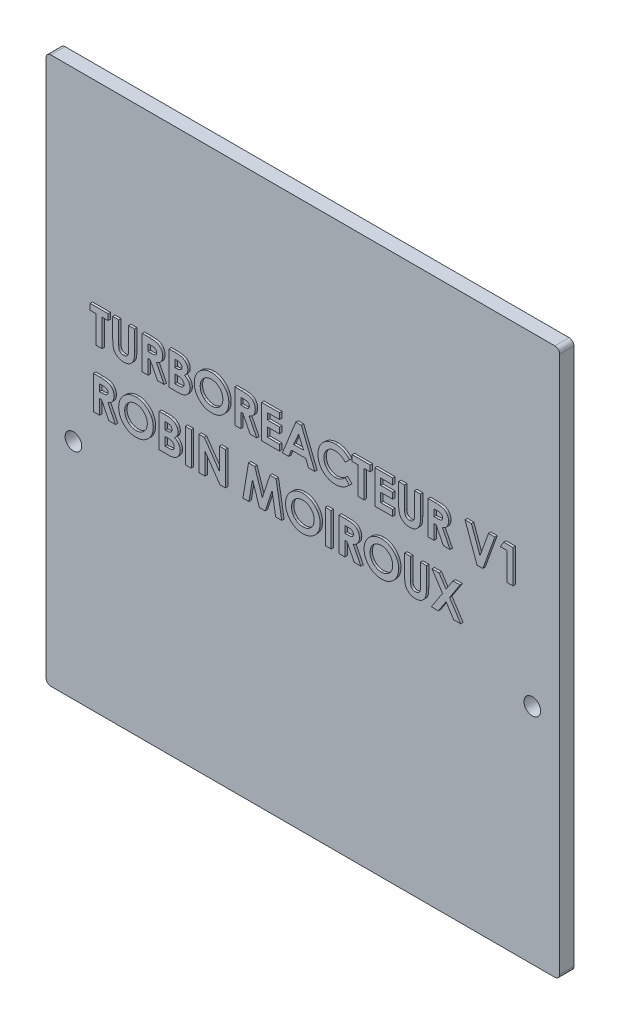
from build123d import *

# Parameters (mm, degrees)
ESQUISSE2_W        = 108
ESQUISSE2_H        = 115
ESQUISSE2_R        = 1.75
BOSS_EXTRU_1_DEPTH = 3
CONG_1_R           = 1
ESQUISSE3_W        = 1.256410256
ESQUISSE3_H        = 7
BOSS_EXTRU_2_DEPTH = 0.5


with BuildPart() as part:
    # Esquisse2 → Boss.-Extru.1 (new body)
    with BuildSketch(Plane.XY):
        with Locations((54, 57.5)):
            Rectangle(ESQUISSE2_W, ESQUISSE2_H)
        with Locations((5.75, 47)):
            Circle(ESQUISSE2_R, mode=Mode.SUBTRACT)
        with Locations((102.25, 47)):
            Circle(ESQUISSE2_R, mode=Mode.SUBTRACT)
    extrude(amount=BOSS_EXTRU_1_DEPTH)

    # Congé1
    cong_1_edges = [part.edges().sort_by_distance(p)[0] for p in [
        (108, 0, 1.5),
        (0, 0, 1.5),
        (0, 115, 1.5),
        (108, 115, 1.5),
    ]]
    fillet(cong_1_edges, radius=CONG_1_R)

    # Esquisse3 → Boss.-Extru.2 (add)
    # profile 1 of 27: a face of its own
    with BuildSketch(Plane.XY.offset(3)):
        Polygon((9.759604729, 74.38249429), (13.528835498, 74.38249429), (13.528835498, 73.126084033), (12.272425242, 73.126084033), (12.272425242, 67.38249429), (11.016014986, 67.38249429), (11.016014986, 73.126084033), (9.759604729, 73.126084033), align=None)
    # profile 2 of 27: a face of its own
    with BuildSketch(Plane.XY.offset(3)):
        with BuildLine():
            Line((14.516014986, 74.38249429), (15.772425242, 74.38249429))
            Line((15.772425242, 74.38249429), (15.772425242, 69.82800711))
            add(Edge.make_bspline(
                [(15.772425242, 69.82800711), (15.772493559, 69.780788162), (15.772625514, 69.689585253), (15.779231217, 69.558738938), (15.78527589, 69.438463778), (15.796182198, 69.328891449), (15.812294551, 69.22997508), (15.827896567, 69.141079266), (15.849012353, 69.063795588), (15.880746004, 68.975826529), (15.929637141, 68.876988486), (16.009522548, 68.77397721), (16.101703473, 68.67996447), (16.212187621, 68.601711826), (16.336362033, 68.538412491), (16.473544425, 68.491514689), (16.623541419, 68.465445738), (16.727256112, 68.461465835), (16.780638383, 68.459417366)],
                knots=[0, 0, 0, 0, 1.155499968, 2.231836252, 3.205919964, 4.102923608, 4.924856345, 5.658536265, 6.31071849, 6.882491295, 7.94666036, 8.992281882, 10.060072772, 11.158554251, 12.289267114, 13.461410017, 14.693379945, 16, 16, 16, 16], degree=3))
            add(Edge.make_bspline(
                [(16.780638383, 68.459417366), (16.837350458, 68.461072266), (16.947929403, 68.464299039), (17.106979612, 68.495973315), (17.254340532, 68.54640961), (17.386892031, 68.618395057), (17.504502198, 68.704682231), (17.604056739, 68.803076649), (17.682624818, 68.913774559), (17.733832569, 69.015901811), (17.762583199, 69.109901052), (17.784133229, 69.193885808), (17.799931784, 69.292979506), (17.814264753, 69.405634585), (17.822877764, 69.533017935), (17.832217169, 69.674105122), (17.835640148, 69.829861502), (17.83622357, 69.938317593), (17.836527806, 69.994874097)],
                knots=[0, 0, 0, 0, 1.261321664, 2.459363699, 3.594844139, 4.716940403, 5.803436589, 6.833651888, 7.818396249, 8.814403945, 9.360733334, 10.004355033, 10.743453831, 11.592799886, 12.532235708, 13.585170094, 14.740740724, 16, 16, 16, 16], degree=3))
            Line((17.836527806, 69.994874097), (17.836527806, 74.38249429))
            Line((17.836527806, 74.38249429), (19.092938062, 74.38249429))
            Line((19.092938062, 74.38249429), (19.092938062, 70.206612879))
            add(Edge.make_bspline(
                [(19.092938062, 70.206612879), (19.092763587, 70.122009722), (19.092428088, 69.9593261), (19.087275832, 69.725538288), (19.076307611, 69.512010622), (19.067095571, 69.318680712), (19.049267118, 69.145809003), (19.030694052, 68.992657286), (19.007021082, 68.859768293), (18.971797126, 68.708490325), (18.911011006, 68.534299285), (18.813015812, 68.333725853), (18.688617255, 68.137352314), (18.541584378, 67.947338913), (18.37557081, 67.770822586), (18.194257428, 67.615864099), (18.00052485, 67.484785929), (17.79234871, 67.380793095), (17.569906176, 67.299686524), (17.330996346, 67.245186993), (17.075782137, 67.208366426), (16.899500859, 67.204829357), (16.808683255, 67.20300711)],
                knots=[0, 0, 0, 0, 1.170808336, 2.251350247, 3.235597562, 4.129743112, 4.929140599, 5.639994148, 6.264258765, 6.79612947, 7.788252245, 8.809469599, 9.879094798, 10.999557536, 12.129761673, 13.226370002, 14.293821979, 15.358369427, 16.438775801, 17.562147481, 18.744053101, 20, 20, 20, 20], degree=3))
            add(Edge.make_bspline(
                [(16.808683255, 67.20300711), (16.748342232, 67.204023475), (16.629290632, 67.206028742), (16.454204369, 67.223709959), (16.284949102, 67.249765424), (16.12184286, 67.287777664), (15.964319533, 67.336882379), (15.812420971, 67.397326863), (15.666711665, 67.468773964), (15.528006984, 67.550566525), (15.396477617, 67.639011099), (15.276266564, 67.737055633), (15.163237082, 67.837449362), (15.060654545, 67.944417282), (14.967748467, 68.056836411), (14.884710188, 68.174961528), (14.811663076, 68.298782141), (14.74676967, 68.430530109), (14.691227248, 68.576901705), (14.644402899, 68.743103428), (14.603496047, 68.931740324), (14.573096487, 69.143237381), (14.545536068, 69.376897529), (14.528091843, 69.633329488), (14.518965983, 69.912540615), (14.517023507, 70.106111901), (14.516014986, 70.206612879)],
                knots=[0, 0, 0, 0, 1.001158378, 1.975264943, 2.917723546, 3.841610987, 4.75185031, 5.653588123, 6.552117133, 7.442167995, 8.324307438, 9.179605724, 10.014504199, 10.831958861, 11.636465792, 12.43274043, 13.225645099, 14.020104002, 14.867201867, 15.819789774, 16.883317127, 18.068162734, 19.364263498, 20.787406516, 22.332041935, 24, 24, 24, 24], degree=3))
            Line((14.516014986, 70.206612879), (14.516014986, 74.38249429))
        make_face()
    # profile 3 of 27: a face of its own
    with BuildSketch(Plane.XY.offset(3)):
        with BuildLine():
            Line((20.708322678, 74.38249429), (22.172264986, 74.38249429))
            add(Edge.make_bspline(
                [(22.172264986, 74.38249429), (22.269031126, 74.382150825), (22.455139673, 74.381490247), (22.723498032, 74.371068067), (22.97002209, 74.356564749), (23.195076849, 74.334432301), (23.398566025, 74.30508735), (23.580693563, 74.270494508), (23.74145414, 74.231068549), (23.882203548, 74.181940693), (24.009222929, 74.126525216), (24.127622651, 74.062851817), (24.240014789, 73.991629519), (24.345648121, 73.910984272), (24.445440627, 73.822366862), (24.539580571, 73.725688088), (24.626737669, 73.620128153), (24.706372239, 73.506354063), (24.77895274, 73.38666633), (24.84309868, 73.260900621), (24.895262265, 73.128969474), (24.941354385, 72.99277958), (24.974553045, 72.850384078), (24.997642227, 72.703169212), (25.014547224, 72.55061677), (25.01551918, 72.446979414), (25.016014986, 72.394112879)],
                knots=[0, 0, 0, 0, 1.749336639, 3.364467119, 4.854658419, 6.213483162, 7.451590619, 8.570285859, 9.5643256, 10.440900261, 11.26203566, 12.067320669, 12.869050712, 13.665104639, 14.467235401, 15.27997916, 16.102287765, 16.939272006, 17.78853747, 18.631303466, 19.488103222, 20.351255419, 21.228522269, 22.127379805, 23.044756219, 24, 24, 24, 24], degree=3))
            add(Edge.make_bspline(
                [(25.016014986, 72.394112879), (25.014727061, 72.338932362), (25.012201676, 72.230733425), (24.998598579, 72.071798011), (24.973736391, 71.919739724), (24.93607899, 71.775003772), (24.892796698, 71.635788747), (24.835242353, 71.504663254), (24.770286587, 71.379720262), (24.69314052, 71.262727137), (24.608476481, 71.151085228), (24.510013985, 71.049071951), (24.404131888, 70.951204478), (24.284878174, 70.863612896), (24.157509655, 70.780374579), (24.019495654, 70.704938496), (23.871736898, 70.635408359), (23.767855175, 70.596633551), (23.714732934, 70.576805187)],
                knots=[0, 0, 0, 0, 1.099860209, 2.156625411, 3.176576793, 4.16617041, 5.135385252, 6.078461593, 7.016046972, 7.938469504, 8.868247731, 9.803980173, 10.76021508, 11.73834243, 12.748633912, 13.790971185, 14.870363756, 16, 16, 16, 16], degree=3))
            Line((23.714732934, 70.576805187), (25.33011755, 67.38249429))
            Line((25.33011755, 67.38249429), (23.933482934, 67.38249429))
            Line((23.933482934, 67.38249429), (22.391014986, 70.433776341))
            Line((22.391014986, 70.433776341), (21.964732934, 70.433776341))
            Line((21.964732934, 70.433776341), (21.964732934, 67.38249429))
            Line((21.964732934, 67.38249429), (20.708322678, 67.38249429))
            Line((20.708322678, 67.38249429), (20.708322678, 74.38249429))
        make_face()
        with BuildLine():
            Line((21.964732934, 71.690186597), (22.454115947, 71.690186597))
            add(Edge.make_bspline(
                [(22.454115947, 71.690186597), (22.513947088, 71.690860456), (22.628510868, 71.69215075), (22.79326863, 71.69813567), (22.94290797, 71.712556369), (23.078071491, 71.730776383), (23.199439323, 71.751814021), (23.305928907, 71.781962234), (23.399181086, 71.814266806), (23.478090818, 71.854413011), (23.54550948, 71.900067952), (23.603721179, 71.9519331), (23.651870601, 72.011960405), (23.691500031, 72.078518584), (23.722327419, 72.152196327), (23.744829051, 72.232184819), (23.757404136, 72.319395233), (23.758850942, 72.379582293), (23.759604729, 72.410939802)],
                knots=[0, 0, 0, 0, 1.688639943, 3.233382647, 4.650958383, 5.928841754, 7.082724185, 8.122798841, 9.049171256, 9.863274652, 10.613301712, 11.341792392, 12.054588806, 12.776240173, 13.521029143, 14.301969904, 15.115324896, 16, 16, 16, 16], degree=3))
            add(Edge.make_bspline(
                [(23.759604729, 72.410939802), (23.758179625, 72.448038025), (23.755380273, 72.520910608), (23.727601998, 72.625821575), (23.683384984, 72.722923853), (23.62277557, 72.811778709), (23.546445892, 72.889675011), (23.458851564, 72.95834122), (23.35810209, 73.012637321), (23.264815658, 73.048450451), (23.17994681, 73.069877816), (23.103355352, 73.085845299), (23.014661983, 73.097161913), (22.913799744, 73.109165196), (22.801025736, 73.116948717), (22.675725273, 73.122629136), (22.538258218, 73.124953275), (22.442430624, 73.125696261), (22.392417229, 73.126084033)],
                knots=[0, 0, 0, 0, 1.020303359, 2.004196876, 2.966617323, 3.9489082, 4.950758222, 5.960522915, 7.003732012, 8.091992268, 8.70421221, 9.413913587, 10.24622431, 11.166358409, 12.212345909, 13.359657661, 14.621978493, 16, 16, 16, 16], degree=3))
            Line((22.392417229, 73.126084033), (21.964732934, 73.126084033))
            Line((21.964732934, 73.126084033), (21.964732934, 71.690186597))
        make_face(mode=Mode.SUBTRACT)
    # profile 4 of 27: a face of its own
    with BuildSketch(Plane.XY.offset(3)):
        with BuildLine():
            Line((26.362168832, 67.38249429), (26.362168832, 74.38249429))
            Line((26.362168832, 74.38249429), (27.483963703, 74.38249429))
            add(Edge.make_bspline(
                [(27.483963703, 74.38249429), (27.562496359, 74.382503252), (27.714455558, 74.382520594), (27.933693025, 74.374821694), (28.13701726, 74.364862305), (28.323781207, 74.353720064), (28.494302751, 74.334519756), (28.648322587, 74.314284729), (28.786148446, 74.289882534), (28.871358686, 74.267993009), (28.911447678, 74.25769461)],
                knots=[0, 0, 0, 0, 1.311965854, 2.538629056, 3.664479157, 4.713267157, 5.663616078, 6.530575999, 7.308677837, 8, 8, 8, 8], degree=3))
            add(Edge.make_bspline(
                [(28.911447678, 74.25769461), (28.964088595, 74.243168536), (29.067386973, 74.214663714), (29.215343215, 74.157096995), (29.355700349, 74.093107506), (29.488287004, 74.020107466), (29.612289044, 73.937215562), (29.727235218, 73.843773937), (29.835604633, 73.743533335), (29.933549337, 73.633700078), (30.022075212, 73.517640897), (30.098988325, 73.395386202), (30.165815962, 73.268805347), (30.219295577, 73.136305397), (30.259591461, 72.998496549), (30.289063703, 72.855967269), (30.308165707, 72.708266559), (30.309970595, 72.607780939), (30.31088678, 72.556773136)],
                knots=[0, 0, 0, 0, 1.099996261, 2.158545794, 3.195537121, 4.207578794, 5.205712374, 6.197378256, 7.190519799, 8.17788031, 9.159561366, 10.129234751, 11.085776129, 12.040971148, 13.00380137, 13.975669004, 14.972423361, 16, 16, 16, 16], degree=3))
            add(Edge.make_bspline(
                [(30.31088678, 72.556773136), (30.308491229, 72.491241498), (30.30377588, 72.36225052), (30.273653912, 72.172786111), (30.217170528, 71.993715013), (30.143263394, 71.821737011), (30.042772798, 71.657493586), (29.915169177, 71.501062831), (29.76251929, 71.347628008), (29.6454284, 71.255654182), (29.584524601, 71.207814802)],
                knots=[0, 0, 0, 0, 0.986156485, 1.941127874, 2.875419072, 3.804401753, 4.751181392, 5.761612777, 6.835722519, 8, 8, 8, 8], degree=3))
            add(Edge.make_bspline(
                [(29.584524601, 71.207814802), (29.633878118, 71.18262026), (29.730646711, 71.133220732), (29.868029684, 71.052022656), (29.99523132, 70.965658204), (30.112821953, 70.875865063), (30.218334985, 70.778836772), (30.316127227, 70.680164235), (30.401374116, 70.574193926), (30.477604453, 70.464702828), (30.543862624, 70.350105497), (30.601566184, 70.230595463), (30.650306311, 70.105764452), (30.691580711, 69.976247755), (30.72236317, 69.841599894), (30.742433988, 69.701772713), (30.757801461, 69.557243095), (30.758996906, 69.458793128), (30.759604729, 69.408736277)],
                knots=[0, 0, 0, 0, 1.164658916, 2.283573913, 3.35186032, 4.395461096, 5.390182219, 6.362969632, 7.312859996, 8.245001507, 9.165155236, 10.092416118, 11.032087915, 11.979892451, 12.947605196, 13.931445124, 14.948243989, 16, 16, 16, 16], degree=3))
            add(Edge.make_bspline(
                [(30.759604729, 69.408736277), (30.75566036, 69.313130552), (30.747876165, 69.124453039), (30.690961923, 68.847431116), (30.592290712, 68.584789207), (30.459795623, 68.337571164), (30.296536181, 68.112933542), (30.108834641, 67.916152936), (29.898580725, 67.749582522), (29.704596075, 67.637160414), (29.53681463, 67.561714667), (29.397844393, 67.515069349), (29.248593305, 67.471857196), (29.086327443, 67.44151273), (28.913988467, 67.413738139), (28.72989606, 67.39658953), (28.534394289, 67.384968341), (28.400115221, 67.383335646), (28.330918832, 67.38249429)],
                knots=[0, 0, 0, 0, 1.284142165, 2.534249414, 3.780121997, 5.041676246, 6.291546858, 7.49970053, 8.684500223, 9.883330709, 10.50184324, 11.153274765, 11.851151195, 12.587658647, 13.369265475, 14.195992086, 15.070362669, 16, 16, 16, 16], degree=3))
            Line((28.330918832, 67.38249429), (26.362168832, 67.38249429))
        make_face()
        with BuildLine():
            Line((27.618579088, 73.126084033), (27.618579088, 71.600443007))
            Line((27.618579088, 71.600443007), (27.952313062, 71.600443007))
            add(Edge.make_bspline(
                [(27.952313062, 71.600443007), (27.997670508, 71.600838542), (28.085230312, 71.601602096), (28.21170116, 71.611436415), (28.329298625, 71.628214373), (28.437576685, 71.651623845), (28.537543988, 71.681350461), (28.628561916, 71.717117982), (28.710230278, 71.760758246), (28.805110026, 71.825762344), (28.905404761, 71.921418786), (28.993693089, 72.059614335), (29.045694325, 72.21853869), (29.05148586, 72.330624451), (29.054476524, 72.388503905)],
                knots=[0, 0, 0, 0, 1.065314748, 2.056525647, 2.977365736, 3.853934255, 4.656397591, 5.425096493, 6.14721249, 6.826394842, 8.123232004, 9.372140726, 10.643011755, 12, 12, 12, 12], degree=3))
            add(Edge.make_bspline(
                [(29.054476524, 72.388503905), (29.052083445, 72.44271763), (29.047456523, 72.547537689), (28.995097965, 72.694714388), (28.913774773, 72.825143064), (28.817761314, 72.914410827), (28.727345986, 72.975378077), (28.649926834, 73.015522414), (28.5649535, 73.051459215), (28.470780994, 73.078937369), (28.36794709, 73.099556008), (28.256951312, 73.11469793), (28.137602152, 73.125004165), (28.055167433, 73.125716356), (28.012609537, 73.126084033)],
                knots=[0, 0, 0, 0, 1.347982417, 2.606269829, 3.849316587, 5.153353503, 5.842674298, 6.568177932, 7.326619318, 8.142485038, 9.012069166, 9.942760135, 10.937925643, 12, 12, 12, 12], degree=3))
            Line((28.012609537, 73.126084033), (27.618579088, 73.126084033))
        make_face(mode=Mode.SUBTRACT)
        with BuildLine():
            Line((27.618579088, 70.433776341), (27.618579088, 68.638904546))
            Line((27.618579088, 68.638904546), (27.980357934, 68.638904546))
            add(Edge.make_bspline(
                [(27.980357934, 68.638904546), (28.051882073, 68.639313161), (28.189396154, 68.640098774), (28.386384832, 68.649590845), (28.565496788, 68.666698631), (28.726257441, 68.688056324), (28.868913029, 68.716992657), (28.99298134, 68.753781496), (29.100163811, 68.794255627), (29.189817771, 68.844245984), (29.26305992, 68.902422363), (29.32915328, 68.961880019), (29.383041688, 69.030470044), (29.425679201, 69.105248056), (29.462581894, 69.184356517), (29.484838993, 69.270884583), (29.501784766, 69.362267769), (29.502717337, 69.425475543), (29.503194473, 69.457814802)],
                knots=[0, 0, 0, 0, 1.753078804, 3.370512758, 4.83203934, 6.162291463, 7.344201807, 8.395507345, 9.331626367, 10.147333109, 10.898971645, 11.62040215, 12.321813352, 13.025280112, 13.727906689, 14.453419512, 15.208716525, 16, 16, 16, 16], degree=3))
            add(Edge.make_bspline(
                [(29.503194473, 69.457814802), (29.502142252, 69.494795254), (29.50009281, 69.566823225), (29.48335499, 69.672099791), (29.452936903, 69.770382451), (29.414623839, 69.864184425), (29.361309174, 69.950147275), (29.297946518, 70.031245849), (29.221388253, 70.1047339), (29.135294017, 70.175056259), (29.034873616, 70.236627294), (28.920079934, 70.290051074), (28.790289349, 70.334668647), (28.645099822, 70.370193188), (28.485147852, 70.400342374), (28.309265965, 70.418344767), (28.118918967, 70.431733938), (27.986929261, 70.43308007), (27.918659216, 70.433776341)],
                knots=[0, 0, 0, 0, 0.845221588, 1.646264278, 2.427170338, 3.19324141, 3.95557735, 4.731569926, 5.540061037, 6.376114724, 7.268642756, 8.224665384, 9.265483498, 10.400594375, 11.639216012, 12.983232105, 14.439614077, 16, 16, 16, 16], degree=3))
            Line((27.918659216, 70.433776341), (27.618579088, 70.433776341))
        make_face(mode=Mode.SUBTRACT)
    # profile 5 of 27: a face of its own
    with BuildSketch(Plane.XY.offset(3)):
        with BuildLine():
            add(Edge.make_bspline(
                [(35.305678447, 74.561981469), (35.427382026, 74.558830345), (35.667652456, 74.552609314), (36.021003554, 74.500752159), (36.361522672, 74.41625836), (36.689055827, 74.298805868), (37.002782914, 74.145213473), (37.303810554, 73.959835619), (37.591060479, 73.739173412), (37.861589184, 73.488374536), (38.111606498, 73.215641709), (38.328246647, 72.921996332), (38.512989418, 72.615047053), (38.666104721, 72.293971392), (38.782730523, 71.956545747), (38.864571673, 71.604490542), (38.917150557, 71.237905934), (38.923197938, 70.988311782), (38.926271396, 70.861460636)],
                knots=[0, 0, 0, 0, 1.014329547, 2.002516266, 2.970391464, 3.935626869, 4.897733899, 5.877609409, 6.878433252, 7.912639331, 8.949961323, 9.958554974, 10.949718813, 11.932905612, 12.9188844, 13.919928257, 14.942845884, 16, 16, 16, 16], degree=3))
            add(Edge.make_bspline(
                [(38.926271396, 70.861460636), (38.922998296, 70.736038809), (38.916548548, 70.488891075), (38.866718173, 70.125684688), (38.783498808, 69.777400728), (38.668851071, 69.443250846), (38.518512701, 69.124853548), (38.337372615, 68.820175913), (38.120650871, 68.532045422), (37.876252162, 68.260616697), (37.607190393, 68.014236886), (37.322211266, 67.797115103), (37.02263064, 67.613134298), (36.708887005, 67.462378743), (36.380307552, 67.345382909), (36.037703913, 67.262833846), (35.681097287, 67.212667114), (35.438587489, 67.206259495), (35.315494152, 67.20300711)],
                knots=[0, 0, 0, 0, 1.051557043, 2.072126891, 3.067553643, 4.050577992, 5.02905126, 6.015227836, 7.017913613, 8.04756643, 9.074058332, 10.072836633, 11.047628519, 12.017157415, 12.98668631, 13.966869689, 14.968021931, 16, 16, 16, 16], degree=3))
            add(Edge.make_bspline(
                [(35.315494152, 67.20300711), (35.186753282, 67.20592466), (34.933795068, 67.211657246), (34.563589591, 67.266171525), (34.208900755, 67.348289071), (33.872708151, 67.470845105), (33.551587945, 67.624050452), (33.247899501, 67.812732023), (32.961744878, 68.036578005), (32.694765507, 68.289855621), (32.45288155, 68.566996885), (32.239371513, 68.859772054), (32.05927106, 69.165944583), (31.912573602, 69.485657768), (31.796923219, 69.816924668), (31.715345014, 70.161762794), (31.667154821, 70.5193451), (31.660442207, 70.762222151), (31.657040627, 70.885298777)],
                knots=[0, 0, 0, 0, 1.067978421, 2.098431617, 3.099715153, 4.085208694, 5.062210972, 6.048429807, 7.046490867, 8.072918869, 9.098532598, 10.095778865, 11.076610158, 12.041847152, 13.011192615, 13.984257998, 14.978533688, 16, 16, 16, 16], degree=3))
            add(Edge.make_bspline(
                [(31.657040627, 70.885298777), (31.658108239, 70.968098288), (31.660229944, 71.132648878), (31.685788122, 71.376504453), (31.722584551, 71.615600295), (31.777004722, 71.848983125), (31.843111321, 72.07829935), (31.928761759, 72.301414439), (32.026255136, 72.520711873), (32.140166967, 72.733601475), (32.26682591, 72.938124484), (32.405022093, 73.133316129), (32.555103009, 73.316816256), (32.716585197, 73.489830754), (32.890025148, 73.651222386), (33.073141437, 73.803275875), (33.269485455, 73.941952139), (33.474759847, 74.07063793), (33.687807323, 74.187006259), (33.907760587, 74.2860555), (34.130088167, 74.372553515), (34.357760059, 74.440821573), (34.588336354, 74.496425193), (34.824280294, 74.53319682), (35.063460258, 74.558754291), (35.22474744, 74.56090319), (35.305678447, 74.561981469)],
                knots=[0, 0, 0, 0, 1.034744296, 2.056386356, 3.06226378, 4.057406941, 5.050368692, 6.043467995, 7.042652155, 8.049140477, 9.059438543, 10.048523776, 11.036952808, 12.020949711, 13.004946614, 13.997082645, 14.994316842, 16.007702937, 17.024872941, 18.026463647, 19.021641123, 20.005082605, 20.995858141, 21.984425357, 22.988620895, 24, 24, 24, 24], degree=3))
        make_face()
        with BuildLine():
            add(Edge.make_bspline(
                [(35.286047037, 73.305571213), (35.204140544, 73.303373478), (35.042489904, 73.299036028), (34.805377854, 73.265990528), (34.577741912, 73.213213109), (34.360843955, 73.136765663), (34.153743928, 73.039467466), (33.956074706, 72.92165849), (33.770573599, 72.779289184), (33.594767131, 72.62000272), (33.435954916, 72.442520994), (33.295639314, 72.25231914), (33.178217756, 72.049714792), (33.079876465, 71.836590098), (33.005847268, 71.610548526), (32.953118491, 71.373360684), (32.919795873, 71.124617886), (32.915595515, 70.955050245), (32.913450883, 70.868471854)],
                knots=[0, 0, 0, 0, 1.033739768, 2.040188636, 3.016340934, 3.979330865, 4.937572243, 5.900995986, 6.878200029, 7.884839167, 8.891893314, 9.879764717, 10.863503415, 11.843163062, 12.837761627, 13.859916423, 14.907309254, 16, 16, 16, 16], degree=3))
            add(Edge.make_bspline(
                [(32.913450883, 70.868471854), (32.916294338, 70.772523521), (32.921867038, 70.584480687), (32.961077232, 70.310168866), (33.028161972, 70.051108577), (33.125031033, 69.808566845), (33.245174081, 69.579850425), (33.39437268, 69.367762562), (33.570210517, 69.171033374), (33.705674563, 69.056174679), (33.774428447, 68.997878905)],
                knots=[0, 0, 0, 0, 1.078454662, 2.113592447, 3.107694534, 4.079536787, 5.043276885, 6.005368276, 6.987637804, 8, 8, 8, 8], degree=3))
            add(Edge.make_bspline(
                [(33.774428447, 68.997878905), (33.830751004, 68.954812226), (33.942127161, 68.869649168), (34.119907757, 68.760495238), (34.302986764, 68.666939431), (34.492745743, 68.591347446), (34.688783932, 68.531888061), (34.891074449, 68.490249632), (35.099330666, 68.464117917), (35.240163279, 68.460994682), (35.311287421, 68.459417366)],
                knots=[0, 0, 0, 0, 1.023928204, 2.024787132, 3.009472467, 3.9914905, 4.972207045, 5.96565515, 6.972602802, 8, 8, 8, 8], degree=3))
            add(Edge.make_bspline(
                [(35.311287421, 68.459417366), (35.39178553, 68.461633736), (35.55016809, 68.465994513), (35.782866171, 68.498633204), (36.005798, 68.553869654), (36.220347558, 68.629646476), (36.425896178, 68.728166336), (36.621439288, 68.849629377), (36.80731973, 68.992544188), (36.982902223, 69.153922432), (37.143392922, 69.332103314), (37.283415715, 69.523319685), (37.404570692, 69.723358476), (37.500866974, 69.935050933), (37.577820897, 70.156398779), (37.629915056, 70.388382314), (37.663519175, 70.630045216), (37.667720716, 70.79450536), (37.669861139, 70.878287559)],
                knots=[0, 0, 0, 0, 1.026359118, 2.019393844, 2.989460624, 3.950973911, 4.916101784, 5.890408035, 6.881132271, 7.902007068, 8.92769091, 9.933912415, 10.920395702, 11.90457117, 12.894218921, 13.903490204, 14.931958862, 16, 16, 16, 16], degree=3))
            add(Edge.make_bspline(
                [(37.669861139, 70.878287559), (37.667646657, 70.961587987), (37.663287786, 71.125552175), (37.630591649, 71.366593762), (37.575705494, 71.597553159), (37.499701122, 71.818807544), (37.402647563, 72.030573831), (37.282630992, 72.232107323), (37.140072532, 72.423213187), (36.978253156, 72.60258911), (36.802122712, 72.767424092), (36.613029081, 72.910470893), (36.416263316, 73.034774015), (36.207310649, 73.132148062), (35.990446079, 73.209725758), (35.764346284, 73.266855087), (35.528154899, 73.298803882), (35.367469017, 73.303295328), (35.286047037, 73.305571213)],
                knots=[0, 0, 0, 0, 1.055025985, 2.07665775, 3.074803781, 4.057872707, 5.035505728, 6.020516407, 7.023567878, 8.050795229, 9.077271434, 10.074415901, 11.050397877, 12.019801805, 12.988065821, 13.964604439, 14.968634123, 16, 16, 16, 16], degree=3))
        make_face(mode=Mode.SUBTRACT)
    # profile 6 of 27: a face of its own
    with BuildSketch(Plane.XY.offset(3)):
        with BuildLine():
            Line((40.182681652, 74.38249429), (41.64662396, 74.38249429))
            add(Edge.make_bspline(
                [(41.64662396, 74.38249429), (41.743390101, 74.382150825), (41.929498647, 74.381490247), (42.197857006, 74.371068067), (42.444381065, 74.356564749), (42.669435823, 74.334432301), (42.872924999, 74.30508735), (43.055052537, 74.270494508), (43.215813114, 74.231068549), (43.356562522, 74.181940693), (43.483581903, 74.126525216), (43.601981626, 74.062851817), (43.714373763, 73.991629519), (43.820007095, 73.910984272), (43.919799601, 73.822366862), (44.013939545, 73.725688088), (44.101096643, 73.620128153), (44.180731214, 73.506354063), (44.253311714, 73.38666633), (44.317457655, 73.260900621), (44.36962124, 73.128969474), (44.415713359, 72.99277958), (44.448912019, 72.850384078), (44.472001202, 72.703169212), (44.488906198, 72.55061677), (44.489878154, 72.446979414), (44.49037396, 72.394112879)],
                knots=[0, 0, 0, 0, 1.749336639, 3.364467119, 4.854658419, 6.213483162, 7.451590619, 8.570285859, 9.5643256, 10.440900261, 11.26203566, 12.067320669, 12.869050712, 13.665104639, 14.467235401, 15.27997916, 16.102287765, 16.939272006, 17.78853747, 18.631303466, 19.488103222, 20.351255419, 21.228522269, 22.127379805, 23.044756219, 24, 24, 24, 24], degree=3))
            add(Edge.make_bspline(
                [(44.49037396, 72.394112879), (44.489086036, 72.338932362), (44.486560651, 72.230733425), (44.472957554, 72.071798011), (44.448095365, 71.919739724), (44.410437964, 71.775003772), (44.367155673, 71.635788747), (44.309601328, 71.504663254), (44.244645561, 71.379720262), (44.167499495, 71.262727137), (44.082835456, 71.151085228), (43.984372959, 71.049071951), (43.878490863, 70.951204478), (43.759237148, 70.863612896), (43.631868629, 70.780374579), (43.493854629, 70.704938496), (43.346095872, 70.635408359), (43.242214149, 70.596633551), (43.189091909, 70.576805187)],
                knots=[0, 0, 0, 0, 1.099860209, 2.156625411, 3.176576793, 4.16617041, 5.135385252, 6.078461593, 7.016046972, 7.938469504, 8.868247731, 9.803980173, 10.76021508, 11.73834243, 12.748633912, 13.790971185, 14.870363756, 16, 16, 16, 16], degree=3))
            Line((43.189091909, 70.576805187), (44.804476524, 67.38249429))
            Line((44.804476524, 67.38249429), (43.407841909, 67.38249429))
            Line((43.407841909, 67.38249429), (41.86537396, 70.433776341))
            Line((41.86537396, 70.433776341), (41.439091909, 70.433776341))
            Line((41.439091909, 70.433776341), (41.439091909, 67.38249429))
            Line((41.439091909, 67.38249429), (40.182681652, 67.38249429))
            Line((40.182681652, 67.38249429), (40.182681652, 74.38249429))
        make_face()
        with BuildLine():
            Line((41.439091909, 71.690186597), (41.928474921, 71.690186597))
            add(Edge.make_bspline(
                [(41.928474921, 71.690186597), (41.988306063, 71.690860456), (42.102869842, 71.69215075), (42.267627604, 71.69813567), (42.417266945, 71.712556369), (42.552430465, 71.730776383), (42.673798297, 71.751814021), (42.780287881, 71.781962234), (42.873540061, 71.814266806), (42.952449792, 71.854413011), (43.019868454, 71.900067952), (43.078080153, 71.9519331), (43.126229575, 72.011960405), (43.165859006, 72.078518584), (43.196686394, 72.152196327), (43.219188025, 72.232184819), (43.23176311, 72.319395233), (43.233209916, 72.379582293), (43.233963703, 72.410939802)],
                knots=[0, 0, 0, 0, 1.688639943, 3.233382647, 4.650958383, 5.928841754, 7.082724185, 8.122798841, 9.049171256, 9.863274652, 10.613301712, 11.341792392, 12.054588806, 12.776240173, 13.521029143, 14.301969904, 15.115324896, 16, 16, 16, 16], degree=3))
            add(Edge.make_bspline(
                [(43.233963703, 72.410939802), (43.2325386, 72.448038025), (43.229739247, 72.520910608), (43.201960972, 72.625821575), (43.157743959, 72.722923853), (43.097134544, 72.811778709), (43.020804866, 72.889675011), (42.933210539, 72.95834122), (42.832461064, 73.012637321), (42.739174632, 73.048450451), (42.654305785, 73.069877816), (42.577714327, 73.085845299), (42.489020958, 73.097161913), (42.388158718, 73.109165196), (42.27538471, 73.116948717), (42.150084248, 73.122629136), (42.012617192, 73.124953275), (41.916789599, 73.125696261), (41.866776203, 73.126084033)],
                knots=[0, 0, 0, 0, 1.020303359, 2.004196876, 2.966617323, 3.9489082, 4.950758222, 5.960522915, 7.003732012, 8.091992268, 8.70421221, 9.413913587, 10.24622431, 11.166358409, 12.212345909, 13.359657661, 14.621978493, 16, 16, 16, 16], degree=3))
            Line((41.866776203, 73.126084033), (41.439091909, 73.126084033))
            Line((41.439091909, 73.126084033), (41.439091909, 71.690186597))
        make_face(mode=Mode.SUBTRACT)
    # profile 7 of 27: a face of its own
    with BuildSketch(Plane.XY.offset(3)):
        Polygon((45.836527806, 74.38249429), (49.605758575, 74.38249429), (49.605758575, 73.126084033), (47.092938062, 73.126084033), (47.092938062, 71.779930187), (49.605758575, 71.779930187), (49.605758575, 70.523519931), (47.092938062, 70.523519931), (47.092938062, 68.638904546), (49.605758575, 68.638904546), (49.605758575, 67.38249429), (45.836527806, 67.38249429), align=None)
    # profile 8 of 27: a face of its own
    with BuildSketch(Plane.XY.offset(3)):
        Polygon((53.017417229, 74.38249429), (54.182681652, 74.38249429), (57.009604729, 67.38249429), (55.667657614, 67.38249429), (55.123587101, 68.818391725), (52.073707293, 68.818391725), (51.52963678, 67.38249429), (50.189091909, 67.38249429), align=None)
        Polygon((53.599348319, 72.504890123), (52.550470114, 70.074801982), (54.648226524, 70.074801982), align=None, mode=Mode.SUBTRACT)
    # profile 9 of 27: a face of its own
    with BuildSketch(Plane.XY.offset(3)):
        with BuildLine():
            Line((64.323707293, 73.168151341), (63.402433255, 72.287542366))
            add(Edge.make_bspline(
                [(63.402433255, 72.287542366), (63.324283285, 72.368349566), (63.171631912, 72.526191342), (62.925653102, 72.735159944), (62.669844096, 72.909306999), (62.409181147, 73.05597254), (62.138975685, 73.166935475), (61.86235202, 73.247796034), (61.577543829, 73.297093661), (61.384796601, 73.302734182), (61.287849921, 73.305571213)],
                knots=[0, 0, 0, 0, 1.115251505, 2.178435587, 3.19620269, 4.182487026, 5.141301733, 6.088180966, 7.038406374, 8, 8, 8, 8], degree=3))
            add(Edge.make_bspline(
                [(61.287849921, 73.305571213), (61.206887663, 73.303329859), (61.047117566, 73.298906795), (60.812533196, 73.266481375), (60.588141123, 73.211340537), (60.373173216, 73.135346247), (60.168262029, 73.03701367), (59.972977939, 72.916418912), (59.787802412, 72.774651115), (59.615181508, 72.612443793), (59.457273971, 72.435220104), (59.317752608, 72.246122851), (59.200881087, 72.045585245), (59.104966529, 71.835638183), (59.030252797, 71.615309926), (58.976897806, 71.384748809), (58.946038704, 71.14368025), (58.941432777, 70.97980364), (58.939091909, 70.896516725)],
                knots=[0, 0, 0, 0, 1.035432265, 2.043311493, 3.022114605, 3.98653278, 4.95457646, 5.923598177, 6.917315552, 7.932509744, 8.948865224, 9.949768934, 10.933144597, 11.912367597, 12.897413939, 13.903909035, 14.934704909, 16, 16, 16, 16], degree=3))
            add(Edge.make_bspline(
                [(58.939091909, 70.896516725), (58.93976652, 70.838060142), (58.941096193, 70.722841014), (58.955651816, 70.552399946), (58.9790898, 70.387031817), (59.013010371, 70.226987113), (59.055428378, 70.072127141), (59.105194359, 69.921115929), (59.16762505, 69.776040113), (59.236924059, 69.635214732), (59.317518008, 69.502482383), (59.404413152, 69.375911072), (59.498636749, 69.25612124), (59.60079909, 69.14360259), (59.712337984, 69.040113538), (59.830370562, 68.942542044), (59.956887871, 68.853330654), (60.089261826, 68.770240509), (60.22863597, 68.698059393), (60.371228759, 68.632677247), (60.519202189, 68.579577223), (60.670754592, 68.53677376), (60.825344376, 68.500375807), (60.98448357, 68.477964469), (61.146792638, 68.460992625), (61.256486325, 68.459944713), (61.311688062, 68.459417366)],
                knots=[0, 0, 0, 0, 1.103660481, 2.175337485, 3.227646561, 4.255952547, 5.262355991, 6.258840057, 7.255597736, 8.242457506, 9.22035537, 10.185017736, 11.140346927, 12.096287581, 13.051739095, 14.01125915, 14.986044842, 15.97314143, 16.960198552, 17.947847494, 18.933482797, 19.925264591, 20.920966487, 21.929612487, 22.958107872, 24, 24, 24, 24], degree=3))
            add(Edge.make_bspline(
                [(61.311688062, 68.459417366), (61.405319696, 68.46212569), (61.589281509, 68.467446842), (61.85927192, 68.509057496), (62.116545885, 68.577504667), (62.322106551, 68.658336799), (62.483157904, 68.738159579), (62.605763918, 68.811991719), (62.732548092, 68.894581075), (62.86140465, 68.989044656), (62.993782972, 69.094248864), (63.127346276, 69.212497866), (63.265513806, 69.339897892), (63.356025985, 69.430825794), (63.402433255, 69.477446213)],
                knots=[0, 0, 0, 0, 1.404581149, 2.759636711, 4.088442092, 5.392261763, 6.066678138, 6.783632037, 7.538459478, 8.336747902, 9.180226004, 10.074962426, 11.012997595, 12, 12, 12, 12], degree=3))
            Line((63.402433255, 69.477446213), (64.295662421, 68.539345251))
            add(Edge.make_bspline(
                [(64.295662421, 68.539345251), (64.232873219, 68.478724247), (64.110322123, 68.360405012), (63.925457198, 68.192402739), (63.740824933, 68.04143402), (63.560885658, 67.902019354), (63.382691781, 67.778220227), (63.206262198, 67.669912999), (63.033594171, 67.574358426), (62.861102192, 67.493167987), (62.687712926, 67.424228872), (62.509315748, 67.364876819), (62.32536528, 67.314667117), (62.134738037, 67.274154482), (61.939212074, 67.241668818), (61.736957527, 67.219741182), (61.52925679, 67.204999963), (61.388370162, 67.203675342), (61.317297037, 67.20300711)],
                knots=[0, 0, 0, 0, 1.244526981, 2.429050516, 3.560637417, 4.644440555, 5.67424972, 6.652764056, 7.595344123, 8.486817594, 9.369275933, 10.254498637, 11.166417451, 12.086725134, 13.032340136, 13.991389299, 14.986715468, 16, 16, 16, 16], degree=3))
            add(Edge.make_bspline(
                [(61.317297037, 67.20300711), (61.186744509, 67.206335154), (60.931289501, 67.212847212), (60.556926848, 67.26109715), (60.201292376, 67.34198732), (59.863520895, 67.456388333), (59.543719806, 67.602530265), (59.241970926, 67.781693411), (58.958760605, 67.993401764), (58.696376627, 68.235173895), (58.459037831, 68.502190918), (58.249257821, 68.788893946), (58.075727789, 69.096692021), (57.931642064, 69.421037982), (57.818968922, 69.763411945), (57.739666131, 70.124184254), (57.690760679, 70.503006563), (57.685410353, 70.761750932), (57.682681652, 70.893712238)],
                knots=[0, 0, 0, 0, 1.078019885, 2.10938526, 3.111377082, 4.085535484, 5.04941344, 6.010039228, 6.978205633, 7.964457913, 8.951525778, 9.924444315, 10.892603023, 11.863865945, 12.85144698, 13.863884204, 14.910567087, 16, 16, 16, 16], degree=3))
            add(Edge.make_bspline(
                [(57.682681652, 70.893712238), (57.683834669, 70.979776277), (57.686119666, 71.150334166), (57.710135201, 71.401579755), (57.743614253, 71.646499263), (57.796725725, 71.882549615), (57.860746365, 72.112910843), (57.940364443, 72.335079191), (58.035452797, 72.549693192), (58.142946506, 72.757112124), (58.264553064, 72.955977169), (58.400400938, 73.144579764), (58.546992876, 73.324375887), (58.707851242, 73.492980207), (58.880638554, 73.651873104), (59.066134926, 73.800193506), (59.263224692, 73.940068495), (59.472441298, 74.067891036), (59.689720225, 74.183513318), (59.912321012, 74.285497108), (60.139696757, 74.370732072), (60.370886093, 74.441431331), (60.606865792, 74.494203328), (60.845951492, 74.534150028), (61.090177525, 74.556480488), (61.254154148, 74.560136127), (61.336928447, 74.561981469)],
                knots=[0, 0, 0, 0, 1.071919942, 2.124283339, 3.142214191, 4.149696895, 5.136002878, 6.119640489, 7.086990633, 8.058538607, 9.028339693, 9.988281803, 10.952401235, 11.916291999, 12.888973767, 13.874849856, 14.873389453, 15.898127285, 16.927174885, 17.938320013, 18.946391617, 19.950418109, 20.947802303, 21.956882652, 22.968648068, 24, 24, 24, 24], degree=3))
            add(Edge.make_bspline(
                [(61.336928447, 74.561981469), (61.407543412, 74.560923673), (61.548039141, 74.558819079), (61.757260859, 74.541274998), (61.96480932, 74.513722196), (62.169941436, 74.472150886), (62.374124522, 74.422800488), (62.574675384, 74.358182948), (62.774757819, 74.286154523), (62.971233833, 74.200059248), (63.164377676, 74.106078479), (63.34966465, 73.999453883), (63.530205706, 73.886747019), (63.702000163, 73.761287402), (63.8682661, 73.627625684), (64.028134099, 73.485138258), (64.180201225, 73.331449442), (64.27563011, 73.222859221), (64.323707293, 73.168151341)],
                knots=[0, 0, 0, 0, 0.996412454, 1.982464992, 2.961075852, 3.949442424, 4.934965278, 5.923860011, 6.921385422, 7.934793307, 8.949617135, 9.951082467, 10.950285876, 11.951772932, 12.951063433, 13.960125323, 14.972308753, 16, 16, 16, 16], degree=3))
        make_face()
    # profile 10 of 27: a face of its own
    with BuildSketch(Plane.XY.offset(3)):
        Polygon((64.862168832, 74.38249429), (68.631399601, 74.38249429), (68.631399601, 73.126084033), (67.374989345, 73.126084033), (67.374989345, 67.38249429), (66.118579088, 67.38249429), (66.118579088, 73.126084033), (64.862168832, 73.126084033), align=None)
    # profile 11 of 27: a face of its own
    with BuildSketch(Plane.XY.offset(3)):
        Polygon((69.618579088, 74.38249429), (73.387809857, 74.38249429), (73.387809857, 73.126084033), (70.874989345, 73.126084033), (70.874989345, 71.779930187), (73.387809857, 71.779930187), (73.387809857, 70.523519931), (70.874989345, 70.523519931), (70.874989345, 68.638904546), (73.387809857, 68.638904546), (73.387809857, 67.38249429), (69.618579088, 67.38249429), align=None)
    # profile 12 of 27: a face of its own
    with BuildSketch(Plane.XY.offset(3)):
        with BuildLine():
            Line((74.644220114, 74.38249429), (75.90063037, 74.38249429))
            Line((75.90063037, 74.38249429), (75.90063037, 69.82800711))
            add(Edge.make_bspline(
                [(75.90063037, 69.82800711), (75.900698688, 69.780788162), (75.900830642, 69.689585253), (75.907436345, 69.558738938), (75.913481019, 69.438463778), (75.924387326, 69.328891449), (75.94049968, 69.22997508), (75.956101696, 69.141079266), (75.977217482, 69.063795588), (76.008951132, 68.975826529), (76.05784227, 68.876988486), (76.137727676, 68.77397721), (76.229908601, 68.67996447), (76.340392749, 68.601711826), (76.464567161, 68.538412491), (76.601749553, 68.491514689), (76.751746547, 68.465445738), (76.85546124, 68.461465835), (76.908843511, 68.459417366)],
                knots=[0, 0, 0, 0, 1.155499968, 2.231836252, 3.205919964, 4.102923608, 4.924856345, 5.658536265, 6.31071849, 6.882491295, 7.94666036, 8.992281882, 10.060072772, 11.158554251, 12.289267114, 13.461410017, 14.693379945, 16, 16, 16, 16], degree=3))
            add(Edge.make_bspline(
                [(76.908843511, 68.459417366), (76.965555586, 68.461072266), (77.076134531, 68.464299039), (77.23518474, 68.495973315), (77.38254566, 68.54640961), (77.515097159, 68.618395057), (77.632707326, 68.704682231), (77.732261868, 68.803076649), (77.810829946, 68.913774559), (77.862037697, 69.015901811), (77.890788327, 69.109901052), (77.912338357, 69.193885808), (77.928136913, 69.292979506), (77.942469882, 69.405634585), (77.951082892, 69.533017935), (77.960422297, 69.674105122), (77.963845276, 69.829861502), (77.964428698, 69.938317593), (77.964732934, 69.994874097)],
                knots=[0, 0, 0, 0, 1.261321664, 2.459363699, 3.594844139, 4.716940403, 5.803436589, 6.833651888, 7.818396249, 8.814403945, 9.360733334, 10.004355033, 10.743453831, 11.592799886, 12.532235708, 13.585170094, 14.740740724, 16, 16, 16, 16], degree=3))
            Line((77.964732934, 69.994874097), (77.964732934, 74.38249429))
            Line((77.964732934, 74.38249429), (79.221143191, 74.38249429))
            Line((79.221143191, 74.38249429), (79.221143191, 70.206612879))
            add(Edge.make_bspline(
                [(79.221143191, 70.206612879), (79.220968715, 70.122009722), (79.220633216, 69.9593261), (79.21548096, 69.725538288), (79.204512739, 69.512010622), (79.195300699, 69.318680712), (79.177472246, 69.145809003), (79.15889918, 68.992657286), (79.13522621, 68.859768293), (79.100002255, 68.708490325), (79.039216135, 68.534299285), (78.94122094, 68.333725853), (78.816822383, 68.137352314), (78.669789506, 67.947338913), (78.503775938, 67.770822586), (78.322462556, 67.615864099), (78.128729978, 67.484785929), (77.920553838, 67.380793095), (77.698111304, 67.299686524), (77.459201474, 67.245186993), (77.203987265, 67.208366426), (77.027705987, 67.204829357), (76.936888383, 67.20300711)],
                knots=[0, 0, 0, 0, 1.170808336, 2.251350247, 3.235597562, 4.129743112, 4.929140599, 5.639994148, 6.264258765, 6.79612947, 7.788252245, 8.809469599, 9.879094798, 10.999557536, 12.129761673, 13.226370002, 14.293821979, 15.358369427, 16.438775801, 17.562147481, 18.744053101, 20, 20, 20, 20], degree=3))
            add(Edge.make_bspline(
                [(76.936888383, 67.20300711), (76.87654736, 67.204023475), (76.75749576, 67.206028742), (76.582409497, 67.223709959), (76.41315423, 67.249765424), (76.250047989, 67.287777664), (76.092524662, 67.336882379), (75.940626099, 67.397326863), (75.794916793, 67.468773964), (75.656212113, 67.550566525), (75.524682745, 67.639011099), (75.404471692, 67.737055633), (75.29144221, 67.837449362), (75.188859674, 67.944417282), (75.095953596, 68.056836411), (75.012915317, 68.174961528), (74.939868204, 68.298782141), (74.874974798, 68.430530109), (74.819432376, 68.576901705), (74.772608027, 68.743103428), (74.731701175, 68.931740324), (74.701301616, 69.143237381), (74.673741197, 69.376897529), (74.656296971, 69.633329488), (74.647171111, 69.912540615), (74.645228635, 70.106111901), (74.644220114, 70.206612879)],
                knots=[0, 0, 0, 0, 1.001158378, 1.975264943, 2.917723546, 3.841610987, 4.75185031, 5.653588123, 6.552117133, 7.442167995, 8.324307438, 9.179605724, 10.014504199, 10.831958861, 11.636465792, 12.43274043, 13.225645099, 14.020104002, 14.867201867, 15.819789774, 16.883317127, 18.068162734, 19.364263498, 20.787406516, 22.332041935, 24, 24, 24, 24], degree=3))
            Line((74.644220114, 70.206612879), (74.644220114, 74.38249429))
        make_face()
    # profile 13 of 27: a face of its own
    with BuildSketch(Plane.XY.offset(3)):
        with BuildLine():
            Line((80.836527806, 74.38249429), (82.300470114, 74.38249429))
            add(Edge.make_bspline(
                [(82.300470114, 74.38249429), (82.397236255, 74.382150825), (82.583344801, 74.381490247), (82.85170316, 74.371068067), (83.098227218, 74.356564749), (83.323281977, 74.334432301), (83.526771153, 74.30508735), (83.708898691, 74.270494508), (83.869659268, 74.231068549), (84.010408676, 74.181940693), (84.137428057, 74.126525216), (84.255827779, 74.062851817), (84.368219917, 73.991629519), (84.473853249, 73.910984272), (84.573645755, 73.822366862), (84.667785699, 73.725688088), (84.754942797, 73.620128153), (84.834577367, 73.506354063), (84.907157868, 73.38666633), (84.971303808, 73.260900621), (85.023467393, 73.128969474), (85.069559513, 72.99277958), (85.102758173, 72.850384078), (85.125847356, 72.703169212), (85.142752352, 72.55061677), (85.143724308, 72.446979414), (85.144220114, 72.394112879)],
                knots=[0, 0, 0, 0, 1.749336639, 3.364467119, 4.854658419, 6.213483162, 7.451590619, 8.570285859, 9.5643256, 10.440900261, 11.26203566, 12.067320669, 12.869050712, 13.665104639, 14.467235401, 15.27997916, 16.102287765, 16.939272006, 17.78853747, 18.631303466, 19.488103222, 20.351255419, 21.228522269, 22.127379805, 23.044756219, 24, 24, 24, 24], degree=3))
            add(Edge.make_bspline(
                [(85.144220114, 72.394112879), (85.142932189, 72.338932362), (85.140406804, 72.230733425), (85.126803707, 72.071798011), (85.101941519, 71.919739724), (85.064284118, 71.775003772), (85.021001827, 71.635788747), (84.963447482, 71.504663254), (84.898491715, 71.379720262), (84.821345648, 71.262727137), (84.736681609, 71.151085228), (84.638219113, 71.049071951), (84.532337017, 70.951204478), (84.413083302, 70.863612896), (84.285714783, 70.780374579), (84.147700782, 70.704938496), (83.999942026, 70.635408359), (83.896060303, 70.596633551), (83.842938062, 70.576805187)],
                knots=[0, 0, 0, 0, 1.099860209, 2.156625411, 3.176576793, 4.16617041, 5.135385252, 6.078461593, 7.016046972, 7.938469504, 8.868247731, 9.803980173, 10.76021508, 11.73834243, 12.748633912, 13.790971185, 14.870363756, 16, 16, 16, 16], degree=3))
            Line((83.842938062, 70.576805187), (85.458322678, 67.38249429))
            Line((85.458322678, 67.38249429), (84.061688062, 67.38249429))
            Line((84.061688062, 67.38249429), (82.519220114, 70.433776341))
            Line((82.519220114, 70.433776341), (82.092938062, 70.433776341))
            Line((82.092938062, 70.433776341), (82.092938062, 67.38249429))
            Line((82.092938062, 67.38249429), (80.836527806, 67.38249429))
            Line((80.836527806, 67.38249429), (80.836527806, 74.38249429))
        make_face()
        with BuildLine():
            Line((82.092938062, 71.690186597), (82.582321075, 71.690186597))
            add(Edge.make_bspline(
                [(82.582321075, 71.690186597), (82.642152217, 71.690860456), (82.756715996, 71.69215075), (82.921473758, 71.69813567), (83.071113098, 71.712556369), (83.206276619, 71.730776383), (83.327644451, 71.751814021), (83.434134035, 71.781962234), (83.527386214, 71.814266806), (83.606295946, 71.854413011), (83.673714608, 71.900067952), (83.731926307, 71.9519331), (83.780075729, 72.011960405), (83.819705159, 72.078518584), (83.850532547, 72.152196327), (83.873034179, 72.232184819), (83.885609264, 72.319395233), (83.88705607, 72.379582293), (83.887809857, 72.410939802)],
                knots=[0, 0, 0, 0, 1.688639943, 3.233382647, 4.650958383, 5.928841754, 7.082724185, 8.122798841, 9.049171256, 9.863274652, 10.613301712, 11.341792392, 12.054588806, 12.776240173, 13.521029143, 14.301969904, 15.115324896, 16, 16, 16, 16], degree=3))
            add(Edge.make_bspline(
                [(83.887809857, 72.410939802), (83.886384753, 72.448038025), (83.883585401, 72.520910608), (83.855807126, 72.625821575), (83.811590112, 72.722923853), (83.750980698, 72.811778709), (83.67465102, 72.889675011), (83.587056692, 72.95834122), (83.486307218, 73.012637321), (83.393020786, 73.048450451), (83.308151938, 73.069877816), (83.231560481, 73.085845299), (83.142867112, 73.097161913), (83.042004872, 73.109165196), (82.929230864, 73.116948717), (82.803930401, 73.122629136), (82.666463346, 73.124953275), (82.570635753, 73.125696261), (82.520622357, 73.126084033)],
                knots=[0, 0, 0, 0, 1.020303359, 2.004196876, 2.966617323, 3.9489082, 4.950758222, 5.960522915, 7.003732012, 8.091992268, 8.70421221, 9.413913587, 10.24622431, 11.166358409, 12.212345909, 13.359657661, 14.621978493, 16, 16, 16, 16], degree=3))
            Line((82.520622357, 73.126084033), (82.092938062, 73.126084033))
            Line((82.092938062, 73.126084033), (82.092938062, 71.690186597))
        make_face(mode=Mode.SUBTRACT)
    # profile 14 of 27: a face of its own
    with BuildSketch(Plane.XY.offset(3)):
        Polygon((88.599348319, 74.38249429), (89.941295434, 74.38249429), (91.74037396, 69.41013852), (93.543659216, 74.38249429), (94.881399601, 74.38249429), (92.343338703, 67.38249429), (91.133202486, 67.38249429), align=None)
    # profile 15 of 27: a face of its own
    with BuildSketch(Plane.XY.offset(3)):
        Polygon((96.753394793, 74.38249429), (98.695502165, 74.38249429), (98.695502165, 67.38249429), (97.439091909, 67.38249429), (97.439091909, 73.215827623), (96.003194473, 73.215827623), align=None)
    # profile 16 of 27: a face of its own
    with BuildSketch(Plane.XY.offset(3)):
        with BuildLine():
            Line((10.477553447, 61.985058392), (11.941495755, 61.985058392))
            add(Edge.make_bspline(
                [(11.941495755, 61.985058392), (12.038261896, 61.984714928), (12.224370442, 61.984054349), (12.492728801, 61.97363217), (12.739252859, 61.959128852), (12.964307618, 61.936996403), (13.167796794, 61.907651452), (13.349924332, 61.873058611), (13.510684909, 61.833632651), (13.651434317, 61.784504795), (13.778453698, 61.729089319), (13.89685342, 61.66541592), (14.009245558, 61.594193622), (14.11487889, 61.513548374), (14.214671396, 61.424930964), (14.30881134, 61.32825219), (14.395968438, 61.222692256), (14.475603008, 61.108918166), (14.548183509, 60.989230432), (14.612329449, 60.863464723), (14.664493035, 60.731533576), (14.710585154, 60.595343683), (14.743783814, 60.452948181), (14.766872997, 60.305733314), (14.783777993, 60.153180872), (14.784749949, 60.049543516), (14.785245755, 59.996676982)],
                knots=[0, 0, 0, 0, 1.749336639, 3.364467119, 4.854658419, 6.213483162, 7.451590619, 8.570285859, 9.5643256, 10.440900261, 11.26203566, 12.067320669, 12.869050712, 13.665104639, 14.467235401, 15.27997916, 16.102287765, 16.939272006, 17.78853747, 18.631303466, 19.488103222, 20.351255419, 21.228522269, 22.127379805, 23.044756219, 24, 24, 24, 24], degree=3))
            add(Edge.make_bspline(
                [(14.785245755, 59.996676982), (14.78395783, 59.941496465), (14.781432445, 59.833297528), (14.767829348, 59.674362114), (14.74296716, 59.522303827), (14.705309759, 59.377567875), (14.662027468, 59.23835285), (14.604473123, 59.107227357), (14.539517356, 58.982284364), (14.46237129, 58.865291239), (14.37770725, 58.75364933), (14.279244754, 58.651636053), (14.173362658, 58.553768581), (14.054108943, 58.466176999), (13.926740424, 58.382938681), (13.788726423, 58.307502599), (13.640967667, 58.237972461), (13.537085944, 58.199197654), (13.483963703, 58.17936929)],
                knots=[0, 0, 0, 0, 1.099860209, 2.156625411, 3.176576793, 4.16617041, 5.135385252, 6.078461593, 7.016046972, 7.938469504, 8.868247731, 9.803980173, 10.76021508, 11.73834243, 12.748633912, 13.790971185, 14.870363756, 16, 16, 16, 16], degree=3))
            Line((13.483963703, 58.17936929), (15.099348319, 54.985058392))
            Line((15.099348319, 54.985058392), (13.702713703, 54.985058392))
            Line((13.702713703, 54.985058392), (12.160245755, 58.036340443))
            Line((12.160245755, 58.036340443), (11.733963703, 58.036340443))
            Line((11.733963703, 58.036340443), (11.733963703, 54.985058392))
            Line((11.733963703, 54.985058392), (10.477553447, 54.985058392))
            Line((10.477553447, 54.985058392), (10.477553447, 61.985058392))
        make_face()
        with BuildLine():
            Line((11.733963703, 59.2927507), (12.223346716, 59.2927507))
            add(Edge.make_bspline(
                [(12.223346716, 59.2927507), (12.283177858, 59.293424558), (12.397741637, 59.294714853), (12.562499399, 59.300699772), (12.712138739, 59.315120471), (12.84730226, 59.333340486), (12.968670092, 59.354378124), (13.075159676, 59.384526336), (13.168411855, 59.416830909), (13.247321587, 59.456977113), (13.314740249, 59.502632054), (13.372951948, 59.554497203), (13.42110137, 59.614524508), (13.4607308, 59.681082687), (13.491558189, 59.754760429), (13.51405982, 59.834748922), (13.526634905, 59.921959336), (13.528081711, 59.982146396), (13.528835498, 60.013503905)],
                knots=[0, 0, 0, 0, 1.688639943, 3.233382647, 4.650958383, 5.928841754, 7.082724185, 8.122798841, 9.049171256, 9.863274652, 10.613301712, 11.341792392, 12.054588806, 12.776240173, 13.521029143, 14.301969904, 15.115324896, 16, 16, 16, 16], degree=3))
            add(Edge.make_bspline(
                [(13.528835498, 60.013503905), (13.527410394, 60.050602127), (13.524611042, 60.12347471), (13.496832767, 60.228385677), (13.452615753, 60.325487955), (13.392006339, 60.414342812), (13.315676661, 60.492239113), (13.228082333, 60.560905323), (13.127332859, 60.615201424), (13.034046427, 60.651014554), (12.949177579, 60.672441919), (12.872586122, 60.688409402), (12.783892753, 60.699726015), (12.683030513, 60.711729298), (12.570256505, 60.71951282), (12.444956043, 60.725193239), (12.307488987, 60.727517378), (12.211661394, 60.728260364), (12.161647998, 60.728648136)],
                knots=[0, 0, 0, 0, 1.020303359, 2.004196876, 2.966617323, 3.9489082, 4.950758222, 5.960522915, 7.003732012, 8.091992268, 8.70421221, 9.413913587, 10.24622431, 11.166358409, 12.212345909, 13.359657661, 14.621978493, 16, 16, 16, 16], degree=3))
            Line((12.161647998, 60.728648136), (11.733963703, 60.728648136))
            Line((11.733963703, 60.728648136), (11.733963703, 59.2927507))
        make_face(mode=Mode.SUBTRACT)
    # profile 17 of 27: a face of its own
    with BuildSketch(Plane.XY.offset(3)):
        with BuildLine():
            add(Edge.make_bspline(
                [(19.421063062, 62.164545572), (19.542766641, 62.161394448), (19.783037072, 62.155173416), (20.13638817, 62.103316262), (20.476907287, 62.018822463), (20.804440442, 61.901369971), (21.118167529, 61.747777575), (21.419195169, 61.562399722), (21.706445095, 61.341737514), (21.9769738, 61.090938638), (22.226991114, 60.818205811), (22.443631262, 60.524560435), (22.628374033, 60.217611156), (22.781489336, 59.896535495), (22.898115139, 59.559109849), (22.979956289, 59.207054644), (23.032535172, 58.840470037), (23.038582553, 58.590875885), (23.041656011, 58.464024738)],
                knots=[0, 0, 0, 0, 1.014329547, 2.002516266, 2.970391464, 3.935626869, 4.897733899, 5.877609409, 6.878433252, 7.912639331, 8.949961323, 9.958554974, 10.949718813, 11.932905612, 12.9188844, 13.919928257, 14.942845884, 16, 16, 16, 16], degree=3))
            add(Edge.make_bspline(
                [(23.041656011, 58.464024738), (23.038382911, 58.338602911), (23.031933163, 58.091455177), (22.982102789, 57.728248791), (22.898883424, 57.379964831), (22.784235686, 57.045814948), (22.633897316, 56.727417651), (22.45275723, 56.422740016), (22.236035486, 56.134609525), (21.991636777, 55.863180799), (21.722575008, 55.616800989), (21.437595882, 55.399679206), (21.138015256, 55.215698401), (20.82427162, 55.064942846), (20.495692167, 54.947947011), (20.153088528, 54.865397949), (19.796481903, 54.815231217), (19.553972104, 54.808823598), (19.430878768, 54.805571213)],
                knots=[0, 0, 0, 0, 1.051557043, 2.072126891, 3.067553643, 4.050577992, 5.02905126, 6.015227836, 7.017913613, 8.04756643, 9.074058332, 10.072836633, 11.047628519, 12.017157415, 12.98668631, 13.966869689, 14.968021931, 16, 16, 16, 16], degree=3))
            add(Edge.make_bspline(
                [(19.430878768, 54.805571213), (19.302137897, 54.808488762), (19.049179684, 54.814221349), (18.678974206, 54.868735627), (18.32428537, 54.950853174), (17.988092766, 55.073409208), (17.66697256, 55.226614555), (17.363284116, 55.415296125), (17.077129494, 55.639142108), (16.810150123, 55.892419724), (16.568266166, 56.169560988), (16.354756128, 56.462336157), (16.174655675, 56.768508686), (16.027958217, 57.08822187), (15.912307834, 57.41948877), (15.830729629, 57.764326897), (15.782539437, 58.121909203), (15.775826823, 58.364786253), (15.772425242, 58.487862879)],
                knots=[0, 0, 0, 0, 1.067978421, 2.098431617, 3.099715153, 4.085208694, 5.062210972, 6.048429807, 7.046490867, 8.072918869, 9.098532598, 10.095778865, 11.076610158, 12.041847152, 13.011192615, 13.984257998, 14.978533688, 16, 16, 16, 16], degree=3))
            add(Edge.make_bspline(
                [(15.772425242, 58.487862879), (15.773492854, 58.57066239), (15.775614559, 58.735212981), (15.801172738, 58.979068556), (15.837969166, 59.218164398), (15.892389337, 59.451547228), (15.958495937, 59.680863453), (16.044146374, 59.903978541), (16.141639751, 60.123275975), (16.255551583, 60.336165578), (16.382210525, 60.540688587), (16.520406708, 60.735880231), (16.670487624, 60.919380359), (16.831969813, 61.092394857), (17.005409763, 61.253786489), (17.188526053, 61.405839977), (17.384870071, 61.544516242), (17.590144462, 61.673202032), (17.803191938, 61.789570361), (18.023145202, 61.888619602), (18.245472782, 61.975117618), (18.473144674, 62.043385676), (18.70372097, 62.098989295), (18.939664909, 62.135760923), (19.178844873, 62.161318393), (19.340132055, 62.163467293), (19.421063062, 62.164545572)],
                knots=[0, 0, 0, 0, 1.034744296, 2.056386356, 3.06226378, 4.057406941, 5.050368692, 6.043467995, 7.042652155, 8.049140477, 9.059438543, 10.048523776, 11.036952808, 12.020949711, 13.004946614, 13.997082645, 14.994316842, 16.007702937, 17.024872941, 18.026463647, 19.021641123, 20.005082605, 20.995858141, 21.984425357, 22.988620895, 24, 24, 24, 24], degree=3))
        make_face()
        with BuildLine():
            add(Edge.make_bspline(
                [(19.401431652, 60.908135315), (19.31952516, 60.90593758), (19.157874519, 60.90160013), (18.920762469, 60.868554631), (18.693126528, 60.815777212), (18.47622857, 60.739329765), (18.269128543, 60.642031568), (18.071459321, 60.524222593), (17.885958215, 60.381853286), (17.710151746, 60.222566823), (17.551339531, 60.045085096), (17.41102393, 59.854883242), (17.293602371, 59.652278895), (17.19526108, 59.4391542), (17.121231884, 59.213112628), (17.068503107, 58.975924786), (17.035180488, 58.727181989), (17.03098013, 58.557614347), (17.028835498, 58.471035956)],
                knots=[0, 0, 0, 0, 1.033739768, 2.040188636, 3.016340934, 3.979330865, 4.937572243, 5.900995986, 6.878200029, 7.884839167, 8.891893314, 9.879764717, 10.863503415, 11.843163062, 12.837761627, 13.859916423, 14.907309254, 16, 16, 16, 16], degree=3))
            add(Edge.make_bspline(
                [(17.028835498, 58.471035956), (17.031678953, 58.375087623), (17.037251653, 58.187044789), (17.076461848, 57.912732969), (17.143546588, 57.65367268), (17.240415648, 57.411130948), (17.360558697, 57.182414528), (17.509757295, 56.970326665), (17.685595133, 56.773597476), (17.821059178, 56.658738782), (17.889813062, 56.600443007)],
                knots=[0, 0, 0, 0, 1.078454662, 2.113592447, 3.107694534, 4.079536787, 5.043276885, 6.005368276, 6.987637804, 8, 8, 8, 8], degree=3))
            add(Edge.make_bspline(
                [(17.889813062, 56.600443007), (17.94613562, 56.557376329), (18.057511777, 56.47221327), (18.235292372, 56.363059341), (18.418371379, 56.269503534), (18.608130358, 56.193911549), (18.804168547, 56.134452164), (19.006459065, 56.092813735), (19.214715281, 56.066682019), (19.355547895, 56.063558784), (19.426672037, 56.061981469)],
                knots=[0, 0, 0, 0, 1.023928204, 2.024787132, 3.009472467, 3.9914905, 4.972207045, 5.96565515, 6.972602802, 8, 8, 8, 8], degree=3))
            add(Edge.make_bspline(
                [(19.426672037, 56.061981469), (19.507170145, 56.064197838), (19.665552705, 56.068558615), (19.898250786, 56.101197306), (20.121182616, 56.156433757), (20.335732173, 56.232210579), (20.541280793, 56.330730439), (20.736823904, 56.45219348), (20.922704346, 56.595108291), (21.098286839, 56.756486535), (21.258777538, 56.934667417), (21.39880033, 57.125883788), (21.519955307, 57.325922579), (21.616251589, 57.537615036), (21.693205512, 57.758962881), (21.745299671, 57.990946417), (21.77890379, 58.232609318), (21.783105331, 58.397069463), (21.785245755, 58.480851661)],
                knots=[0, 0, 0, 0, 1.026359118, 2.019393844, 2.989460624, 3.950973911, 4.916101784, 5.890408035, 6.881132271, 7.902007068, 8.92769091, 9.933912415, 10.920395702, 11.90457117, 12.894218921, 13.903490204, 14.931958862, 16, 16, 16, 16], degree=3))
            add(Edge.make_bspline(
                [(21.785245755, 58.480851661), (21.783031272, 58.564152089), (21.778672402, 58.728116277), (21.745976264, 58.969157865), (21.691090109, 59.200117261), (21.615085737, 59.421371647), (21.518032179, 59.633137933), (21.398015607, 59.834671426), (21.255457147, 60.02577729), (21.093637772, 60.205153212), (20.917507327, 60.369988195), (20.728413696, 60.513034996), (20.531647931, 60.637338118), (20.322695265, 60.734712165), (20.105830694, 60.812289861), (19.8797309, 60.86941919), (19.643539515, 60.901367984), (19.482853632, 60.905859431), (19.401431652, 60.908135315)],
                knots=[0, 0, 0, 0, 1.055025985, 2.07665775, 3.074803781, 4.057872707, 5.035505728, 6.020516407, 7.023567878, 8.050795229, 9.077271434, 10.074415901, 11.050397877, 12.019801805, 12.988065821, 13.964604439, 14.968634123, 16, 16, 16, 16], degree=3))
        make_face(mode=Mode.SUBTRACT)
    # profile 18 of 27: a face of its own
    with BuildSketch(Plane.XY.offset(3)):
        with BuildLine():
            Line((24.298066268, 54.985058392), (24.298066268, 61.985058392))
            Line((24.298066268, 61.985058392), (25.419861139, 61.985058392))
            add(Edge.make_bspline(
                [(25.419861139, 61.985058392), (25.498393795, 61.985067355), (25.650352994, 61.985084697), (25.86959046, 61.977385797), (26.072914696, 61.967426407), (26.259678643, 61.956284166), (26.430200187, 61.937083858), (26.584220023, 61.916848832), (26.722045882, 61.892446636), (26.807256122, 61.870557111), (26.847345114, 61.860258713)],
                knots=[0, 0, 0, 0, 1.311965854, 2.538629056, 3.664479157, 4.713267157, 5.663616078, 6.530575999, 7.308677837, 8, 8, 8, 8], degree=3))
            add(Edge.make_bspline(
                [(26.847345114, 61.860258713), (26.899986031, 61.845732638), (27.003284409, 61.817227817), (27.151240651, 61.759661098), (27.291597785, 61.695671608), (27.42418444, 61.622671569), (27.548186479, 61.539779664), (27.663132654, 61.44633804), (27.771502069, 61.346097437), (27.869446773, 61.236264181), (27.957972648, 61.120205), (28.034885761, 60.997950305), (28.101713398, 60.87136945), (28.155193012, 60.7388695), (28.195488897, 60.601060652), (28.224961139, 60.458531372), (28.244063143, 60.310830662), (28.245868031, 60.210345041), (28.246784216, 60.159337238)],
                knots=[0, 0, 0, 0, 1.099996261, 2.158545794, 3.195537121, 4.207578794, 5.205712374, 6.197378256, 7.190519799, 8.17788031, 9.159561366, 10.129234751, 11.085776129, 12.040971148, 13.00380137, 13.975669004, 14.972423361, 16, 16, 16, 16], degree=3))
            add(Edge.make_bspline(
                [(28.246784216, 60.159337238), (28.244388665, 60.0938056), (28.239673316, 59.964814623), (28.209551348, 59.775350214), (28.153067964, 59.596279115), (28.07916083, 59.424301114), (27.978670234, 59.260057689), (27.851066613, 59.103626934), (27.698416726, 58.950192111), (27.581325836, 58.858218284), (27.520422037, 58.810378905)],
                knots=[0, 0, 0, 0, 0.986156485, 1.941127874, 2.875419072, 3.804401753, 4.751181392, 5.761612777, 6.835722519, 8, 8, 8, 8], degree=3))
            add(Edge.make_bspline(
                [(27.520422037, 58.810378905), (27.569775554, 58.785184362), (27.666544147, 58.735784835), (27.80392712, 58.654586758), (27.931128756, 58.568222306), (28.048719389, 58.478429165), (28.154232421, 58.381400875), (28.252024663, 58.282728338), (28.337271552, 58.176758028), (28.413501889, 58.06726693), (28.47976006, 57.952669599), (28.53746362, 57.833159565), (28.586203747, 57.708328555), (28.627478147, 57.578811858), (28.658260606, 57.444163997), (28.678331424, 57.304336816), (28.693698897, 57.159807198), (28.694894341, 57.061357231), (28.695502165, 57.011300379)],
                knots=[0, 0, 0, 0, 1.164658916, 2.283573913, 3.35186032, 4.395461096, 5.390182219, 6.362969632, 7.312859996, 8.245001507, 9.165155236, 10.092416118, 11.032087915, 11.979892451, 12.947605196, 13.931445124, 14.948243989, 16, 16, 16, 16], degree=3))
            add(Edge.make_bspline(
                [(28.695502165, 57.011300379), (28.691557796, 56.915694655), (28.6837736, 56.727017141), (28.626859359, 56.449995218), (28.528188148, 56.18735331), (28.395693059, 55.940135266), (28.232433617, 55.715497645), (28.044732076, 55.518717039), (27.834478161, 55.352146625), (27.640493511, 55.239724517), (27.472712066, 55.16427877), (27.333741829, 55.117633451), (27.184490741, 55.074421299), (27.022224879, 55.044076833), (26.849885903, 55.016302241), (26.665793496, 54.999153633), (26.470291725, 54.987532444), (26.336012657, 54.985899749), (26.266816268, 54.985058392)],
                knots=[0, 0, 0, 0, 1.284142165, 2.534249414, 3.780121997, 5.041676246, 6.291546858, 7.49970053, 8.684500223, 9.883330709, 10.50184324, 11.153274765, 11.851151195, 12.587658647, 13.369265475, 14.195992086, 15.070362669, 16, 16, 16, 16], degree=3))
            Line((26.266816268, 54.985058392), (24.298066268, 54.985058392))
        make_face()
        with BuildLine():
            Line((25.554476524, 60.728648136), (25.554476524, 59.20300711))
            Line((25.554476524, 59.20300711), (25.888210498, 59.20300711))
            add(Edge.make_bspline(
                [(25.888210498, 59.20300711), (25.933567944, 59.203402644), (26.021127748, 59.204166199), (26.147598596, 59.214000517), (26.265196061, 59.230778475), (26.373474121, 59.254187947), (26.473441424, 59.283914563), (26.564459352, 59.319682085), (26.646127714, 59.363322348), (26.741007462, 59.428326447), (26.841302197, 59.523982888), (26.929590525, 59.662178437), (26.98159176, 59.821102792), (26.987383296, 59.933188553), (26.99037396, 59.991068007)],
                knots=[0, 0, 0, 0, 1.065314748, 2.056525647, 2.977365736, 3.853934255, 4.656397591, 5.425096493, 6.14721249, 6.826394842, 8.123232004, 9.372140726, 10.643011755, 12, 12, 12, 12], degree=3))
            add(Edge.make_bspline(
                [(26.99037396, 59.991068007), (26.987980881, 60.045281733), (26.983353959, 60.150101792), (26.930995401, 60.29727849), (26.849672209, 60.427707167), (26.75365875, 60.516974929), (26.663243422, 60.577942179), (26.585824269, 60.618086517), (26.500850936, 60.654023318), (26.40667843, 60.681501472), (26.303844526, 60.702120111), (26.192848747, 60.717262032), (26.073499588, 60.727568268), (25.991064869, 60.728280459), (25.948506973, 60.728648136)],
                knots=[0, 0, 0, 0, 1.347982417, 2.606269829, 3.849316587, 5.153353503, 5.842674298, 6.568177932, 7.326619318, 8.142485038, 9.012069166, 9.942760135, 10.937925643, 12, 12, 12, 12], degree=3))
            Line((25.948506973, 60.728648136), (25.554476524, 60.728648136))
        make_face(mode=Mode.SUBTRACT)
        with BuildLine():
            Line((25.554476524, 58.036340443), (25.554476524, 56.241468649))
            Line((25.554476524, 56.241468649), (25.91625537, 56.241468649))
            add(Edge.make_bspline(
                [(25.91625537, 56.241468649), (25.987779509, 56.241877263), (26.12529359, 56.242662876), (26.322282268, 56.252154947), (26.501394223, 56.269262733), (26.662154877, 56.290620426), (26.804810465, 56.319556759), (26.928878776, 56.356345598), (27.036061247, 56.396819729), (27.125715207, 56.446810086), (27.198957356, 56.504986465), (27.265050716, 56.564444122), (27.318939124, 56.633034146), (27.361576637, 56.707812159), (27.39847933, 56.78692062), (27.420736428, 56.873448685), (27.437682202, 56.964831872), (27.438614773, 57.028039646), (27.439091909, 57.060378905)],
                knots=[0, 0, 0, 0, 1.753078804, 3.370512758, 4.83203934, 6.162291463, 7.344201807, 8.395507345, 9.331626367, 10.147333109, 10.898971645, 11.62040215, 12.321813352, 13.025280112, 13.727906689, 14.453419512, 15.208716525, 16, 16, 16, 16], degree=3))
            add(Edge.make_bspline(
                [(27.439091909, 57.060378905), (27.438039688, 57.097359356), (27.435990246, 57.169387327), (27.419252426, 57.274663894), (27.388834339, 57.372946554), (27.350521275, 57.466748527), (27.29720661, 57.552711377), (27.233843954, 57.633809951), (27.157285689, 57.707298002), (27.071191453, 57.777620362), (26.970771052, 57.839191397), (26.85597737, 57.892615176), (26.726186785, 57.937232749), (26.580997258, 57.97275729), (26.421045288, 58.002906477), (26.245163401, 58.02090887), (26.054816403, 58.03429804), (25.922826697, 58.035644173), (25.854556652, 58.036340443)],
                knots=[0, 0, 0, 0, 0.845221588, 1.646264278, 2.427170338, 3.19324141, 3.95557735, 4.731569926, 5.540061037, 6.376114724, 7.268642756, 8.224665384, 9.265483498, 10.400594375, 11.639216012, 12.983232105, 14.439614077, 16, 16, 16, 16], degree=3))
            Line((25.854556652, 58.036340443), (25.554476524, 58.036340443))
        make_face(mode=Mode.SUBTRACT)
    # profile 19 of 27: a face of its own
    with BuildSketch(Plane.XY.offset(3)):
        with Locations((30.40063037, 58.485058392)):
            Rectangle(ESQUISSE3_W, ESQUISSE3_H)
    # profile 20 of 27: a face of its own
    with BuildSketch(Plane.XY.offset(3)):
        Polygon((32.644220114, 61.985058392), (33.775830691, 61.985058392), (36.951912421, 57.3786882), (36.951912421, 61.985058392), (38.208322678, 61.985058392), (38.208322678, 54.985058392), (37.068298639, 54.985058392), (33.90063037, 59.577406149), (33.90063037, 54.985058392), (32.644220114, 54.985058392), align=None)
    # profile 21 of 27: a face of its own
    with BuildSketch(Plane.XY.offset(3)):
        Polygon((43.069901203, 61.985058392), (44.373987742, 61.985058392), (45.971143191, 57.102446213), (47.579516588, 61.985058392), (48.870982934, 61.985058392), (50.054476524, 54.985058392), (48.782641588, 54.985058392), (48.035245755, 59.406332431), (46.579716909, 54.985058392), (45.354156011, 54.985058392), (43.907040627, 59.406332431), (43.161047037, 54.985058392), (41.887809857, 54.985058392), align=None)
    # profile 22 of 27: a face of its own
    with BuildSketch(Plane.XY.offset(3)):
        with BuildLine():
            add(Edge.make_bspline(
                [(54.510806652, 62.164545572), (54.632510231, 62.161394448), (54.872780661, 62.155173416), (55.226131759, 62.103316262), (55.566650877, 62.018822463), (55.894184032, 61.901369971), (56.207911119, 61.747777575), (56.508938759, 61.562399722), (56.796188685, 61.341737514), (57.066717389, 61.090938638), (57.316734703, 60.818205811), (57.533374852, 60.524560435), (57.718117623, 60.217611156), (57.871232926, 59.896535495), (57.987858729, 59.559109849), (58.069699878, 59.207054644), (58.122278762, 58.840470037), (58.128326143, 58.590875885), (58.131399601, 58.464024738)],
                knots=[0, 0, 0, 0, 1.014329547, 2.002516266, 2.970391464, 3.935626869, 4.897733899, 5.877609409, 6.878433252, 7.912639331, 8.949961323, 9.958554974, 10.949718813, 11.932905612, 12.9188844, 13.919928257, 14.942845884, 16, 16, 16, 16], degree=3))
            add(Edge.make_bspline(
                [(58.131399601, 58.464024738), (58.128126501, 58.338602911), (58.121676753, 58.091455177), (58.071846378, 57.728248791), (57.988627014, 57.379964831), (57.873979276, 57.045814948), (57.723640906, 56.727417651), (57.54250082, 56.422740016), (57.325779076, 56.134609525), (57.081380367, 55.863180799), (56.812318598, 55.616800989), (56.527339472, 55.399679206), (56.227758845, 55.215698401), (55.91401521, 55.064942846), (55.585435757, 54.947947011), (55.242832118, 54.865397949), (54.886225493, 54.815231217), (54.643715694, 54.808823598), (54.520622357, 54.805571213)],
                knots=[0, 0, 0, 0, 1.051557043, 2.072126891, 3.067553643, 4.050577992, 5.02905126, 6.015227836, 7.017913613, 8.04756643, 9.074058332, 10.072836633, 11.047628519, 12.017157415, 12.98668631, 13.966869689, 14.968021931, 16, 16, 16, 16], degree=3))
            add(Edge.make_bspline(
                [(54.520622357, 54.805571213), (54.391881487, 54.808488762), (54.138923273, 54.814221349), (53.768717796, 54.868735627), (53.41402896, 54.950853174), (53.077836356, 55.073409208), (52.75671615, 55.226614555), (52.453027706, 55.415296125), (52.166873084, 55.639142108), (51.899893712, 55.892419724), (51.658009755, 56.169560988), (51.444499718, 56.462336157), (51.264399265, 56.768508686), (51.117701807, 57.08822187), (51.002051424, 57.41948877), (50.920473219, 57.764326897), (50.872283026, 58.121909203), (50.865570412, 58.364786253), (50.862168832, 58.487862879)],
                knots=[0, 0, 0, 0, 1.067978421, 2.098431617, 3.099715153, 4.085208694, 5.062210972, 6.048429807, 7.046490867, 8.072918869, 9.098532598, 10.095778865, 11.076610158, 12.041847152, 13.011192615, 13.984257998, 14.978533688, 16, 16, 16, 16], degree=3))
            add(Edge.make_bspline(
                [(50.862168832, 58.487862879), (50.863236444, 58.57066239), (50.865358149, 58.735212981), (50.890916327, 58.979068556), (50.927712756, 59.218164398), (50.982132927, 59.451547228), (51.048239526, 59.680863453), (51.133889964, 59.903978541), (51.231383341, 60.123275975), (51.345295172, 60.336165578), (51.471954115, 60.540688587), (51.610150298, 60.735880231), (51.760231214, 60.919380359), (51.921713402, 61.092394857), (52.095153353, 61.253786489), (52.278269642, 61.405839977), (52.47461366, 61.544516242), (52.679888052, 61.673202032), (52.892935528, 61.789570361), (53.112888792, 61.888619602), (53.335216372, 61.975117618), (53.562888264, 62.043385676), (53.793464559, 62.098989295), (54.029408499, 62.135760923), (54.268588463, 62.161318393), (54.429875645, 62.163467293), (54.510806652, 62.164545572)],
                knots=[0, 0, 0, 0, 1.034744296, 2.056386356, 3.06226378, 4.057406941, 5.050368692, 6.043467995, 7.042652155, 8.049140477, 9.059438543, 10.048523776, 11.036952808, 12.020949711, 13.004946614, 13.997082645, 14.994316842, 16.007702937, 17.024872941, 18.026463647, 19.021641123, 20.005082605, 20.995858141, 21.984425357, 22.988620895, 24, 24, 24, 24], degree=3))
        make_face()
        with BuildLine():
            add(Edge.make_bspline(
                [(54.491175242, 60.908135315), (54.409268749, 60.90593758), (54.247618109, 60.90160013), (54.010506059, 60.868554631), (53.782870117, 60.815777212), (53.56597216, 60.739329765), (53.358872133, 60.642031568), (53.161202911, 60.524222593), (52.975701805, 60.381853286), (52.799895336, 60.222566823), (52.641083121, 60.045085096), (52.500767519, 59.854883242), (52.383345961, 59.652278895), (52.28500467, 59.4391542), (52.210975474, 59.213112628), (52.158246697, 58.975924786), (52.124924078, 58.727181989), (52.12072372, 58.557614347), (52.118579088, 58.471035956)],
                knots=[0, 0, 0, 0, 1.033739768, 2.040188636, 3.016340934, 3.979330865, 4.937572243, 5.900995986, 6.878200029, 7.884839167, 8.891893314, 9.879764717, 10.863503415, 11.843163062, 12.837761627, 13.859916423, 14.907309254, 16, 16, 16, 16], degree=3))
            add(Edge.make_bspline(
                [(52.118579088, 58.471035956), (52.121422543, 58.375087623), (52.126995243, 58.187044789), (52.166205437, 57.912732969), (52.233290177, 57.65367268), (52.330159238, 57.411130948), (52.450302287, 57.182414528), (52.599500885, 56.970326665), (52.775338723, 56.773597476), (52.910802768, 56.658738782), (52.979556652, 56.600443007)],
                knots=[0, 0, 0, 0, 1.078454662, 2.113592447, 3.107694534, 4.079536787, 5.043276885, 6.005368276, 6.987637804, 8, 8, 8, 8], degree=3))
            add(Edge.make_bspline(
                [(52.979556652, 56.600443007), (53.035879209, 56.557376329), (53.147255367, 56.47221327), (53.325035962, 56.363059341), (53.508114969, 56.269503534), (53.697873948, 56.193911549), (53.893912137, 56.134452164), (54.096202654, 56.092813735), (54.304458871, 56.066682019), (54.445291484, 56.063558784), (54.516415627, 56.061981469)],
                knots=[0, 0, 0, 0, 1.023928204, 2.024787132, 3.009472467, 3.9914905, 4.972207045, 5.96565515, 6.972602802, 8, 8, 8, 8], degree=3))
            add(Edge.make_bspline(
                [(54.516415627, 56.061981469), (54.596913735, 56.064197838), (54.755296295, 56.068558615), (54.987994376, 56.101197306), (55.210926205, 56.156433757), (55.425475763, 56.232210579), (55.631024383, 56.330730439), (55.826567494, 56.45219348), (56.012447935, 56.595108291), (56.188030429, 56.756486535), (56.348521128, 56.934667417), (56.48854392, 57.125883788), (56.609698897, 57.325922579), (56.705995179, 57.537615036), (56.782949102, 57.758962881), (56.835043261, 57.990946417), (56.86864738, 58.232609318), (56.872848921, 58.397069463), (56.874989345, 58.480851661)],
                knots=[0, 0, 0, 0, 1.026359118, 2.019393844, 2.989460624, 3.950973911, 4.916101784, 5.890408035, 6.881132271, 7.902007068, 8.92769091, 9.933912415, 10.920395702, 11.90457117, 12.894218921, 13.903490204, 14.931958862, 16, 16, 16, 16], degree=3))
            add(Edge.make_bspline(
                [(56.874989345, 58.480851661), (56.872774862, 58.564152089), (56.868415991, 58.728116277), (56.835719854, 58.969157865), (56.780833699, 59.200117261), (56.704829327, 59.421371647), (56.607775768, 59.633137933), (56.487759197, 59.834671426), (56.345200737, 60.02577729), (56.183381361, 60.205153212), (56.007250917, 60.369988195), (55.818157286, 60.513034996), (55.621391521, 60.637338118), (55.412438854, 60.734712165), (55.195574284, 60.812289861), (54.969474489, 60.86941919), (54.733283105, 60.901367984), (54.572597222, 60.905859431), (54.491175242, 60.908135315)],
                knots=[0, 0, 0, 0, 1.055025985, 2.07665775, 3.074803781, 4.057872707, 5.035505728, 6.020516407, 7.023567878, 8.050795229, 9.077271434, 10.074415901, 11.050397877, 12.019801805, 12.988065821, 13.964604439, 14.968634123, 16, 16, 16, 16], degree=3))
        make_face(mode=Mode.SUBTRACT)
    # profile 23 of 27: a face of its own
    with BuildSketch(Plane.XY.offset(3)):
        with Locations((59.836527806, 58.485058392)):
            Rectangle(ESQUISSE3_W, ESQUISSE3_H)
    # profile 24 of 27: a face of its own
    with BuildSketch(Plane.XY.offset(3)):
        with BuildLine():
            Line((62.08011755, 61.985058392), (63.544059857, 61.985058392))
            add(Edge.make_bspline(
                [(63.544059857, 61.985058392), (63.640825998, 61.984714928), (63.826934545, 61.984054349), (64.095292904, 61.97363217), (64.341816962, 61.959128852), (64.56687172, 61.936996403), (64.770360897, 61.907651452), (64.952488435, 61.873058611), (65.113249011, 61.833632651), (65.25399842, 61.784504795), (65.381017801, 61.729089319), (65.499417523, 61.66541592), (65.61180966, 61.594193622), (65.717442993, 61.513548374), (65.817235499, 61.424930964), (65.911375443, 61.32825219), (65.99853254, 61.222692256), (66.078167111, 61.108918166), (66.150747612, 60.989230432), (66.214893552, 60.863464723), (66.267057137, 60.731533576), (66.313149256, 60.595343683), (66.346347917, 60.452948181), (66.369437099, 60.305733314), (66.386342095, 60.153180872), (66.387314052, 60.049543516), (66.387809857, 59.996676982)],
                knots=[0, 0, 0, 0, 1.749336639, 3.364467119, 4.854658419, 6.213483162, 7.451590619, 8.570285859, 9.5643256, 10.440900261, 11.26203566, 12.067320669, 12.869050712, 13.665104639, 14.467235401, 15.27997916, 16.102287765, 16.939272006, 17.78853747, 18.631303466, 19.488103222, 20.351255419, 21.228522269, 22.127379805, 23.044756219, 24, 24, 24, 24], degree=3))
            add(Edge.make_bspline(
                [(66.387809857, 59.996676982), (66.386521933, 59.941496465), (66.383996548, 59.833297528), (66.370393451, 59.674362114), (66.345531263, 59.522303827), (66.307873862, 59.377567875), (66.26459157, 59.23835285), (66.207037225, 59.107227357), (66.142081458, 58.982284364), (66.064935392, 58.865291239), (65.980271353, 58.75364933), (65.881808857, 58.651636053), (65.77592676, 58.553768581), (65.656673045, 58.466176999), (65.529304527, 58.382938681), (65.391290526, 58.307502599), (65.24353177, 58.237972461), (65.139650046, 58.199197654), (65.086527806, 58.17936929)],
                knots=[0, 0, 0, 0, 1.099860209, 2.156625411, 3.176576793, 4.16617041, 5.135385252, 6.078461593, 7.016046972, 7.938469504, 8.868247731, 9.803980173, 10.76021508, 11.73834243, 12.748633912, 13.790971185, 14.870363756, 16, 16, 16, 16], degree=3))
            Line((65.086527806, 58.17936929), (66.701912421, 54.985058392))
            Line((66.701912421, 54.985058392), (65.305277806, 54.985058392))
            Line((65.305277806, 54.985058392), (63.762809857, 58.036340443))
            Line((63.762809857, 58.036340443), (63.336527806, 58.036340443))
            Line((63.336527806, 58.036340443), (63.336527806, 54.985058392))
            Line((63.336527806, 54.985058392), (62.08011755, 54.985058392))
            Line((62.08011755, 54.985058392), (62.08011755, 61.985058392))
        make_face()
        with BuildLine():
            Line((63.336527806, 59.2927507), (63.825910819, 59.2927507))
            add(Edge.make_bspline(
                [(63.825910819, 59.2927507), (63.88574196, 59.293424558), (64.00030574, 59.294714853), (64.165063502, 59.300699772), (64.314702842, 59.315120471), (64.449866363, 59.333340486), (64.571234195, 59.354378124), (64.677723779, 59.384526336), (64.770975958, 59.416830909), (64.84988569, 59.456977113), (64.917304352, 59.502632054), (64.975516051, 59.554497203), (65.023665473, 59.614524508), (65.063294903, 59.681082687), (65.094122291, 59.754760429), (65.116623923, 59.834748922), (65.129199007, 59.921959336), (65.130645814, 59.982146396), (65.131399601, 60.013503905)],
                knots=[0, 0, 0, 0, 1.688639943, 3.233382647, 4.650958383, 5.928841754, 7.082724185, 8.122798841, 9.049171256, 9.863274652, 10.613301712, 11.341792392, 12.054588806, 12.776240173, 13.521029143, 14.301969904, 15.115324896, 16, 16, 16, 16], degree=3))
            add(Edge.make_bspline(
                [(65.131399601, 60.013503905), (65.129974497, 60.050602127), (65.127175144, 60.12347471), (65.099396869, 60.228385677), (65.055179856, 60.325487955), (64.994570441, 60.414342812), (64.918240764, 60.492239113), (64.830646436, 60.560905323), (64.729896962, 60.615201424), (64.63661053, 60.651014554), (64.551741682, 60.672441919), (64.475150224, 60.688409402), (64.386456855, 60.699726015), (64.285594616, 60.711729298), (64.172820608, 60.71951282), (64.047520145, 60.725193239), (63.91005309, 60.727517378), (63.814225496, 60.728260364), (63.764212101, 60.728648136)],
                knots=[0, 0, 0, 0, 1.020303359, 2.004196876, 2.966617323, 3.9489082, 4.950758222, 5.960522915, 7.003732012, 8.091992268, 8.70421221, 9.413913587, 10.24622431, 11.166358409, 12.212345909, 13.359657661, 14.621978493, 16, 16, 16, 16], degree=3))
            Line((63.764212101, 60.728648136), (63.336527806, 60.728648136))
            Line((63.336527806, 60.728648136), (63.336527806, 59.2927507))
        make_face(mode=Mode.SUBTRACT)
    # profile 25 of 27: a face of its own
    with BuildSketch(Plane.XY.offset(3)):
        with BuildLine():
            add(Edge.make_bspline(
                [(71.023627165, 62.164545572), (71.145330744, 62.161394448), (71.385601174, 62.155173416), (71.738952272, 62.103316262), (72.07947139, 62.018822463), (72.407004545, 61.901369971), (72.720731632, 61.747777575), (73.021759272, 61.562399722), (73.309009197, 61.341737514), (73.579537902, 61.090938638), (73.829555216, 60.818205811), (74.046195365, 60.524560435), (74.230938136, 60.217611156), (74.384053439, 59.896535495), (74.500679241, 59.559109849), (74.582520391, 59.207054644), (74.635099275, 58.840470037), (74.641146656, 58.590875885), (74.644220114, 58.464024738)],
                knots=[0, 0, 0, 0, 1.014329547, 2.002516266, 2.970391464, 3.935626869, 4.897733899, 5.877609409, 6.878433252, 7.912639331, 8.949961323, 9.958554974, 10.949718813, 11.932905612, 12.9188844, 13.919928257, 14.942845884, 16, 16, 16, 16], degree=3))
            add(Edge.make_bspline(
                [(74.644220114, 58.464024738), (74.640947014, 58.338602911), (74.634497266, 58.091455177), (74.584666891, 57.728248791), (74.501447526, 57.379964831), (74.386799789, 57.045814948), (74.236461419, 56.727417651), (74.055321333, 56.422740016), (73.838599589, 56.134609525), (73.59420088, 55.863180799), (73.325139111, 55.616800989), (73.040159984, 55.399679206), (72.740579358, 55.215698401), (72.426835723, 55.064942846), (72.09825627, 54.947947011), (71.755652631, 54.865397949), (71.399046005, 54.815231217), (71.156536207, 54.808823598), (71.03344287, 54.805571213)],
                knots=[0, 0, 0, 0, 1.051557043, 2.072126891, 3.067553643, 4.050577992, 5.02905126, 6.015227836, 7.017913613, 8.04756643, 9.074058332, 10.072836633, 11.047628519, 12.017157415, 12.98668631, 13.966869689, 14.968021931, 16, 16, 16, 16], degree=3))
            add(Edge.make_bspline(
                [(71.03344287, 54.805571213), (70.904702, 54.808488762), (70.651743786, 54.814221349), (70.281538309, 54.868735627), (69.926849473, 54.950853174), (69.590656869, 55.073409208), (69.269536663, 55.226614555), (68.965848219, 55.415296125), (68.679693596, 55.639142108), (68.412714225, 55.892419724), (68.170830268, 56.169560988), (67.957320231, 56.462336157), (67.777219778, 56.768508686), (67.63052232, 57.08822187), (67.514871937, 57.41948877), (67.433293732, 57.764326897), (67.385103539, 58.121909203), (67.378390925, 58.364786253), (67.374989345, 58.487862879)],
                knots=[0, 0, 0, 0, 1.067978421, 2.098431617, 3.099715153, 4.085208694, 5.062210972, 6.048429807, 7.046490867, 8.072918869, 9.098532598, 10.095778865, 11.076610158, 12.041847152, 13.011192615, 13.984257998, 14.978533688, 16, 16, 16, 16], degree=3))
            add(Edge.make_bspline(
                [(67.374989345, 58.487862879), (67.376056956, 58.57066239), (67.378178662, 58.735212981), (67.40373684, 58.979068556), (67.440533268, 59.218164398), (67.49495344, 59.451547228), (67.561060039, 59.680863453), (67.646710477, 59.903978541), (67.744203854, 60.123275975), (67.858115685, 60.336165578), (67.984774628, 60.540688587), (68.122970811, 60.735880231), (68.273051727, 60.919380359), (68.434533915, 61.092394857), (68.607973866, 61.253786489), (68.791090155, 61.405839977), (68.987434173, 61.544516242), (69.192708565, 61.673202032), (69.405756041, 61.789570361), (69.625709305, 61.888619602), (69.848036884, 61.975117618), (70.075708777, 62.043385676), (70.306285072, 62.098989295), (70.542229012, 62.135760923), (70.781408976, 62.161318393), (70.942696158, 62.163467293), (71.023627165, 62.164545572)],
                knots=[0, 0, 0, 0, 1.034744296, 2.056386356, 3.06226378, 4.057406941, 5.050368692, 6.043467995, 7.042652155, 8.049140477, 9.059438543, 10.048523776, 11.036952808, 12.020949711, 13.004946614, 13.997082645, 14.994316842, 16.007702937, 17.024872941, 18.026463647, 19.021641123, 20.005082605, 20.995858141, 21.984425357, 22.988620895, 24, 24, 24, 24], degree=3))
        make_face()
        with BuildLine():
            add(Edge.make_bspline(
                [(71.003995755, 60.908135315), (70.922089262, 60.90593758), (70.760438622, 60.90160013), (70.523326572, 60.868554631), (70.29569063, 60.815777212), (70.078792673, 60.739329765), (69.871692646, 60.642031568), (69.674023424, 60.524222593), (69.488522317, 60.381853286), (69.312715849, 60.222566823), (69.153903634, 60.045085096), (69.013588032, 59.854883242), (68.896166474, 59.652278895), (68.797825183, 59.4391542), (68.723795986, 59.213112628), (68.671067209, 58.975924786), (68.63774459, 58.727181989), (68.633544233, 58.557614347), (68.631399601, 58.471035956)],
                knots=[0, 0, 0, 0, 1.033739768, 2.040188636, 3.016340934, 3.979330865, 4.937572243, 5.900995986, 6.878200029, 7.884839167, 8.891893314, 9.879764717, 10.863503415, 11.843163062, 12.837761627, 13.859916423, 14.907309254, 16, 16, 16, 16], degree=3))
            add(Edge.make_bspline(
                [(68.631399601, 58.471035956), (68.634243056, 58.375087623), (68.639815756, 58.187044789), (68.67902595, 57.912732969), (68.74611069, 57.65367268), (68.842979751, 57.411130948), (68.963122799, 57.182414528), (69.112321398, 56.970326665), (69.288159235, 56.773597476), (69.423623281, 56.658738782), (69.492377165, 56.600443007)],
                knots=[0, 0, 0, 0, 1.078454662, 2.113592447, 3.107694534, 4.079536787, 5.043276885, 6.005368276, 6.987637804, 8, 8, 8, 8], degree=3))
            add(Edge.make_bspline(
                [(69.492377165, 56.600443007), (69.548699722, 56.557376329), (69.660075879, 56.47221327), (69.837856475, 56.363059341), (70.020935482, 56.269503534), (70.210694461, 56.193911549), (70.40673265, 56.134452164), (70.609023167, 56.092813735), (70.817279384, 56.066682019), (70.958111997, 56.063558784), (71.029236139, 56.061981469)],
                knots=[0, 0, 0, 0, 1.023928204, 2.024787132, 3.009472467, 3.9914905, 4.972207045, 5.96565515, 6.972602802, 8, 8, 8, 8], degree=3))
            add(Edge.make_bspline(
                [(71.029236139, 56.061981469), (71.109734248, 56.064197838), (71.268116808, 56.068558615), (71.500814889, 56.101197306), (71.723746718, 56.156433757), (71.938296276, 56.232210579), (72.143844896, 56.330730439), (72.339388006, 56.45219348), (72.525268448, 56.595108291), (72.700850941, 56.756486535), (72.86134164, 56.934667417), (73.001364433, 57.125883788), (73.12251941, 57.325922579), (73.218815692, 57.537615036), (73.295769615, 57.758962881), (73.347863774, 57.990946417), (73.381467893, 58.232609318), (73.385669434, 58.397069463), (73.387809857, 58.480851661)],
                knots=[0, 0, 0, 0, 1.026359118, 2.019393844, 2.989460624, 3.950973911, 4.916101784, 5.890408035, 6.881132271, 7.902007068, 8.92769091, 9.933912415, 10.920395702, 11.90457117, 12.894218921, 13.903490204, 14.931958862, 16, 16, 16, 16], degree=3))
            add(Edge.make_bspline(
                [(73.387809857, 58.480851661), (73.385595375, 58.564152089), (73.381236504, 58.728116277), (73.348540367, 58.969157865), (73.293654212, 59.200117261), (73.21764984, 59.421371647), (73.120596281, 59.633137933), (73.00057971, 59.834671426), (72.85802125, 60.02577729), (72.696201874, 60.205153212), (72.52007143, 60.369988195), (72.330977799, 60.513034996), (72.134212034, 60.637338118), (71.925259367, 60.734712165), (71.708394797, 60.812289861), (71.482295002, 60.86941919), (71.246103617, 60.901367984), (71.085417735, 60.905859431), (71.003995755, 60.908135315)],
                knots=[0, 0, 0, 0, 1.055025985, 2.07665775, 3.074803781, 4.057872707, 5.035505728, 6.020516407, 7.023567878, 8.050795229, 9.077271434, 10.074415901, 11.050397877, 12.019801805, 12.988065821, 13.964604439, 14.968634123, 16, 16, 16, 16], degree=3))
        make_face(mode=Mode.SUBTRACT)
    # profile 26 of 27: a face of its own
    with BuildSketch(Plane.XY.offset(3)):
        with BuildLine():
            Line((75.90063037, 61.985058392), (77.157040627, 61.985058392))
            Line((77.157040627, 61.985058392), (77.157040627, 57.430571213))
            add(Edge.make_bspline(
                [(77.157040627, 57.430571213), (77.157108944, 57.383352265), (77.157240898, 57.292149355), (77.163846601, 57.16130304), (77.169891275, 57.041027881), (77.180797582, 56.931455552), (77.196909936, 56.832539182), (77.212511952, 56.743643369), (77.233627738, 56.666359691), (77.265361388, 56.578390631), (77.314252526, 56.479552589), (77.394137933, 56.376541313), (77.486318858, 56.282528572), (77.596803006, 56.204275929), (77.720977418, 56.140976594), (77.858159809, 56.094078791), (78.008156803, 56.06800984), (78.111871497, 56.064029937), (78.165253768, 56.061981469)],
                knots=[0, 0, 0, 0, 1.155499968, 2.231836252, 3.205919964, 4.102923608, 4.924856345, 5.658536265, 6.31071849, 6.882491295, 7.94666036, 8.992281882, 10.060072772, 11.158554251, 12.289267114, 13.461410017, 14.693379945, 16, 16, 16, 16], degree=3))
            add(Edge.make_bspline(
                [(78.165253768, 56.061981469), (78.221965843, 56.063636368), (78.332544788, 56.066863142), (78.491594996, 56.098537418), (78.638955916, 56.148973713), (78.771507415, 56.22095916), (78.889117582, 56.307246334), (78.988672124, 56.405640752), (79.067240203, 56.516338662), (79.118447954, 56.618465913), (79.147198584, 56.712465155), (79.168748613, 56.79644991), (79.184547169, 56.895543609), (79.198880138, 57.008198688), (79.207493148, 57.135582037), (79.216832554, 57.276669224), (79.220255532, 57.432425604), (79.220838954, 57.540881695), (79.221143191, 57.5974382)],
                knots=[0, 0, 0, 0, 1.261321664, 2.459363699, 3.594844139, 4.716940403, 5.803436589, 6.833651888, 7.818396249, 8.814403945, 9.360733334, 10.004355033, 10.743453831, 11.592799886, 12.532235708, 13.585170094, 14.740740724, 16, 16, 16, 16], degree=3))
            Line((79.221143191, 57.5974382), (79.221143191, 61.985058392))
            Line((79.221143191, 61.985058392), (80.477553447, 61.985058392))
            Line((80.477553447, 61.985058392), (80.477553447, 57.809176982))
            add(Edge.make_bspline(
                [(80.477553447, 57.809176982), (80.477378972, 57.724573824), (80.477043472, 57.561890203), (80.471891217, 57.32810239), (80.460922996, 57.114574725), (80.451710955, 56.921244814), (80.433882502, 56.748373106), (80.415309437, 56.595221388), (80.391636467, 56.462332396), (80.356412511, 56.311054428), (80.295626391, 56.136863387), (80.197631197, 55.936289956), (80.07323264, 55.739916417), (79.926199763, 55.549903015), (79.760186195, 55.373386688), (79.578872813, 55.218428202), (79.385140235, 55.087350031), (79.176964094, 54.983357197), (78.954521561, 54.902250626), (78.71561173, 54.847751095), (78.460397521, 54.810930529), (78.284116243, 54.80739346), (78.193298639, 54.805571213)],
                knots=[0, 0, 0, 0, 1.170808336, 2.251350247, 3.235597562, 4.129743112, 4.929140599, 5.639994148, 6.264258765, 6.79612947, 7.788252245, 8.809469599, 9.879094798, 10.999557536, 12.129761673, 13.226370002, 14.293821979, 15.358369427, 16.438775801, 17.562147481, 18.744053101, 20, 20, 20, 20], degree=3))
            add(Edge.make_bspline(
                [(78.193298639, 54.805571213), (78.132957617, 54.806587577), (78.013906016, 54.808592844), (77.838819753, 54.826274061), (77.669564486, 54.852329526), (77.506458245, 54.890341766), (77.348934918, 54.939446481), (77.197036356, 54.999890965), (77.05132705, 55.071338067), (76.912622369, 55.153130628), (76.781093001, 55.241575202), (76.660881949, 55.339619735), (76.547852467, 55.440013465), (76.44526993, 55.546981384), (76.352363852, 55.659400514), (76.269325573, 55.777525631), (76.196278461, 55.901346244), (76.131385054, 56.033094211), (76.075842632, 56.179465808), (76.029018284, 56.345667531), (75.988111431, 56.534304426), (75.957711872, 56.745801483), (75.930151453, 56.979461631), (75.912707227, 57.23589359), (75.903581368, 57.515104717), (75.901638891, 57.708676004), (75.90063037, 57.809176982)],
                knots=[0, 0, 0, 0, 1.001158378, 1.975264943, 2.917723546, 3.841610987, 4.75185031, 5.653588123, 6.552117133, 7.442167995, 8.324307438, 9.179605724, 10.014504199, 10.831958861, 11.636465792, 12.43274043, 13.225645099, 14.020104002, 14.867201867, 15.819789774, 16.883317127, 18.068162734, 19.364263498, 20.787406516, 22.332041935, 24, 24, 24, 24], degree=3))
            Line((75.90063037, 57.809176982), (75.90063037, 61.985058392))
        make_face()
    # profile 27 of 27: a face of its own
    with BuildSketch(Plane.XY.offset(3)):
        Polygon((81.665253768, 61.985058392), (83.146022998, 61.985058392), (84.608563062, 59.737261918), (86.073907614, 61.985058392), (87.556079088, 61.985058392), (85.348947678, 58.600042366), (87.701912421, 54.985058392), (86.221143191, 54.985058392), (84.608563062, 57.464225059), (82.991776203, 54.985058392), (81.509604729, 54.985058392), (83.868178447, 58.60144461), align=None)
    extrude(amount=BOSS_EXTRU_2_DEPTH)


solid = part.part
